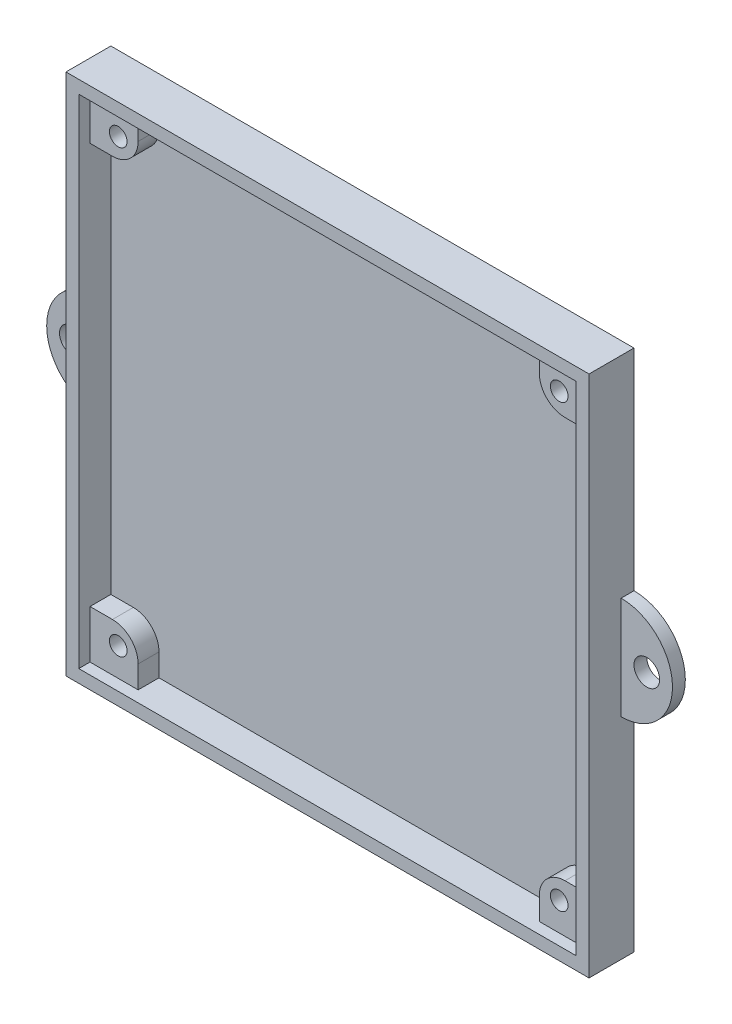
from build123d import *

# Parameters (mm, degrees)
SKETCH1_W           = 81.5
SKETCH1_H           = 81.5
BOSS_EXTRUDE2_DEPTH = 7
SKETCH3_W           = 77.5
SKETCH3_H           = 77.5
CUT_EXTRUDE2_DEPTH  = 5
SKETCH5_W           = 7.5
SKETCH5_H           = 7.5
BOSS_EXTRUDE3_DEPTH = 3.25
SKETCH4_R           = 1.375
CUT_EXTRUDE3_DEPTH  = 3.3
CUT_EXTRUDE4_DEPTH  = 1
FILLET1_R           = 4
SKETCH7_R           = 2
BOSS_EXTRUDE4_DEPTH = 2


with BuildPart() as part:
    # Sketch1 → Boss-Extrude2 (new body)
    with BuildSketch(Plane.XY):
        Rectangle(SKETCH1_W, SKETCH1_H)
    extrude(amount=BOSS_EXTRUDE2_DEPTH)

    # Sketch3 → Cut-Extrude2 (cut)
    with BuildSketch(Plane.XY.offset(7)):
        Rectangle(SKETCH3_W, SKETCH3_H)
    extrude(amount=-CUT_EXTRUDE2_DEPTH, mode=Mode.SUBTRACT)

    # Sketch5 → Boss-Extrude3 (add)
    with BuildSketch(Plane.XY.offset(2)):
        with Locations((-35, 35)):
            Rectangle(SKETCH5_W, SKETCH5_H)
        with Locations((35, 35)):
            Rectangle(SKETCH5_W, SKETCH5_H)
        with Locations((35, -35)):
            Rectangle(SKETCH5_W, SKETCH5_H)
        with Locations((-35, -35)):
            Rectangle(SKETCH5_W, SKETCH5_H)
    extrude(amount=BOSS_EXTRUDE3_DEPTH)

    # Sketch4 → Cut-Extrude3 (cut)
    with BuildSketch(Plane.XY.offset(5.25)):
        with Locations((-34.35, 34.35)):
            Circle(SKETCH4_R)
        with Locations((34.35, 34.35)):
            Circle(SKETCH4_R)
        with Locations((34.35, -34.35)):
            Circle(SKETCH4_R)
        with Locations((-34.35, -34.35)):
            Circle(SKETCH4_R)
    extrude(amount=-CUT_EXTRUDE3_DEPTH, mode=Mode.SUBTRACT)

    # Sketch6 → Cut-Extrude4 (cut)
    # profile 1 of 29: a face of its own
    with BuildSketch(Plane(origin=(0, 0, 0), x_dir=(-1, 0, 0), z_dir=(0, 0, -1))):
        Polygon((-12.80229786, 21.362535762), (-11.459028629, 21.362535762), (-10.132295857, 19.323463246), (-8.803019014, 21.362535762), (-7.458477748, 21.362535762), (-9.460661241, 18.291842653), (-7.326186081, 15.012535762), (-8.669455312, 15.012535762), (-10.132295857, 17.261494096), (-11.598952507, 15.012535762), (-12.943493773, 15.012535762), (-10.803930472, 18.293114689), align=None)
    # profile 2 of 29: a face of its own
    with BuildSketch(Plane(origin=(0, 0, 0), x_dir=(-1, 0, 0), z_dir=(0, 0, -1))):
        Polygon((-7.000545055, 21.362535762), (-5.732325905, 21.362535762), (-4.598942491, 19.135202028), (-3.465559078, 21.362535762), (-2.197339927, 21.362535762), (-4.029070696, 17.762675987), (-4.029070696, 15.012535762), (-5.168814286, 15.012535762), (-5.168814286, 17.762675987), align=None)
    # profile 3 of 29: a face of its own
    with BuildSketch(Plane(origin=(0, 0, 0), x_dir=(-1, 0, 0), z_dir=(0, 0, -1))):
        Polygon((-1.342532235, 21.362535762), (2.483749816, 21.362535762), (0.209350778, 16.152279352), (2.320929304, 16.152279352), (2.320929304, 15.012535762), (-1.505352748, 15.012535762), (0.770318326, 20.222792173), (-1.342532235, 20.222792173), align=None)
    # profile 4 of 29: a face of its own
    with BuildSketch(Plane(origin=(0, 0, 0), x_dir=(-1, 0, 0), z_dir=(0, 0, -1))):
        Polygon((3.053621611, 21.362535762), (6.879903663, 21.362535762), (4.605504624, 16.152279352), (6.71708315, 16.152279352), (6.71708315, 15.012535762), (2.890801099, 15.012535762), (5.166472172, 20.222792173), (3.053621611, 20.222792173), align=None)
    # profile 5 of 29: a face of its own
    with BuildSketch(Plane(origin=(0, 0, 0), x_dir=(-1, 0, 0), z_dir=(0, 0, -1))):
        Polygon((7.246249816, 21.362535762), (8.514468967, 21.362535762), (9.647852381, 19.135202028), (10.781235794, 21.362535762), (12.049454945, 21.362535762), (10.217724175, 17.762675987), (10.217724175, 15.012535762), (9.077980586, 15.012535762), (9.077980586, 17.762675987), align=None)
    # profile 6 of 29: a face of its own
    with BuildSketch(Plane(origin=(0, 0, 0), x_dir=(-1, 0, 0), z_dir=(0, 0, -1))):
        Polygon((-14.354180873, 10.023433198), (-13.171188084, 10.023433198), (-11.722339927, 5.594206436), (-10.263315488, 10.023433198), (-9.091771017, 10.023433198), (-8.01817326, 3.673433198), (-9.171909238, 3.673433198), (-9.84990403, 7.684160362), (-11.170276626, 3.673433198), (-12.28203544, 3.673433198), (-13.594775825, 7.684160362), (-14.271498581, 3.673433198), (-15.426506594, 3.673433198), align=None)
    # profile 7 of 29: a face of its own
    with BuildSketch(Plane(origin=(0, 0, 0), x_dir=(-1, 0, 0), z_dir=(0, 0, -1))):
        with BuildLine():
            add(Edge.make_bspline(
                [(-3.975645216, 10.186253711), (-3.865242683, 10.183395192), (-3.647283079, 10.177751827), (-3.326743154, 10.13070998), (-3.017843669, 10.054062034), (-2.720724307, 9.947515845), (-2.436129021, 9.8081856), (-2.163053947, 9.640021405), (-1.902477229, 9.439849259), (-1.657069047, 9.21233885), (-1.430267626, 8.964931214), (-1.233744063, 8.698552909), (-1.066155978, 8.420106063), (-0.927258524, 8.12884457), (-0.821462261, 7.822751306), (-0.747220646, 7.503386942), (-0.699524087, 7.170842333), (-0.694038249, 6.944424781), (-0.691250184, 6.829352669)],
                knots=[0, 0, 0, 0, 1.014329547, 2.002516266, 2.970391464, 3.935626869, 4.897733899, 5.877609409, 6.878433252, 7.912639331, 8.949961323, 9.958554974, 10.949718813, 11.932905612, 12.9188844, 13.919928257, 14.942845884, 16, 16, 16, 16], degree=3))
            add(Edge.make_bspline(
                [(-0.691250184, 6.829352669), (-0.694219353, 6.715577155), (-0.700070196, 6.491378853), (-0.745273464, 6.161898774), (-0.820765316, 5.845955468), (-0.924767193, 5.542833789), (-1.061145571, 5.254001954), (-1.225465506, 4.977615814), (-1.422063088, 4.716240297), (-1.643767632, 4.470015668), (-1.887845093, 4.246513982), (-2.146361872, 4.049553508), (-2.418124297, 3.882656635), (-2.702734595, 3.74589981), (-3.000803099, 3.639767874), (-3.311593543, 3.564884082), (-3.635086696, 3.519375689), (-3.855077728, 3.513563063), (-3.966740969, 3.510612686)],
                knots=[0, 0, 0, 0, 1.051557043, 2.072126891, 3.067553643, 4.050577992, 5.02905126, 6.015227836, 7.017913613, 8.04756643, 9.074058332, 10.072836633, 11.047628519, 12.017157415, 12.98668631, 13.966869689, 14.968021931, 16, 16, 16, 16], degree=3))
            add(Edge.make_bspline(
                [(-3.966740969, 3.510612686), (-4.08352733, 3.51325932), (-4.312996566, 3.518459595), (-4.648825821, 3.567911833), (-4.970579265, 3.642404179), (-5.275553984, 3.753580009), (-5.566855885, 3.892559146), (-5.842344688, 4.063720285), (-6.10192781, 4.266780569), (-6.34411624, 4.496539549), (-6.563539543, 4.747946267), (-6.757223649, 5.013535171), (-6.920600488, 5.291277394), (-7.05367604, 5.581302925), (-7.158587459, 5.881809327), (-7.232590544, 6.19462677), (-7.276305933, 6.519005005), (-7.282395233, 6.739329187), (-7.285480953, 6.850977269)],
                knots=[0, 0, 0, 0, 1.067978421, 2.098431617, 3.099715153, 4.085208694, 5.062210972, 6.048429807, 7.046490867, 8.072918869, 9.098532598, 10.095778865, 11.076610158, 12.041847152, 13.011192615, 13.984257998, 14.978533688, 16, 16, 16, 16], degree=3))
            add(Edge.make_bspline(
                [(-7.285480953, 6.850977269), (-7.284512476, 6.926088254), (-7.282587786, 7.075359146), (-7.259402867, 7.29657099), (-7.22602325, 7.513465075), (-7.17665638, 7.725176642), (-7.116688251, 7.933199218), (-7.038991068, 8.135596476), (-6.950550648, 8.334530577), (-6.847216344, 8.52765186), (-6.732318589, 8.713183446), (-6.606954908, 8.890250152), (-6.470810078, 9.056710982), (-6.324322664, 9.213659849), (-6.166987851, 9.360065115), (-6.000875217, 9.497999351), (-5.822763144, 9.623798533), (-5.636549946, 9.740534929), (-5.443285449, 9.846097627), (-5.243756417, 9.935949439), (-5.042073541, 10.014415496), (-4.835542611, 10.076344377), (-4.626376971, 10.126784803), (-4.412342112, 10.160141923), (-4.195371716, 10.183326199), (-4.049061201, 10.185275558), (-3.975645216, 10.186253711)],
                knots=[0, 0, 0, 0, 1.034744296, 2.056386356, 3.06226378, 4.057406941, 5.050368692, 6.043467995, 7.042652155, 8.049140477, 9.059438543, 10.048523776, 11.036952808, 12.020949711, 13.004946614, 13.997082645, 14.994316842, 16.007702937, 17.024872941, 18.026463647, 19.021641123, 20.005082605, 20.995858141, 21.984425357, 22.988620895, 24, 24, 24, 24], degree=3))
        make_face()
        with BuildLine():
            add(Edge.make_bspline(
                [(-3.993453709, 9.046510121), (-4.067754599, 9.044516462), (-4.214394822, 9.040581775), (-4.429489325, 9.010604786), (-4.635987643, 8.962728128), (-4.832745076, 8.893379373), (-5.020614387, 8.805116008), (-5.19992861, 8.698246437), (-5.368204613, 8.569097138), (-5.527686195, 8.424601561), (-5.671751562, 8.26360028), (-5.799037858, 8.091060027), (-5.905555986, 7.90726894), (-5.994765585, 7.713934396), (-6.061920642, 7.508882398), (-6.109753175, 7.293719142), (-6.139981551, 7.068073889), (-6.143791875, 6.914251815), (-6.145737363, 6.835712846)],
                knots=[0, 0, 0, 0, 1.033739768, 2.040188636, 3.016340934, 3.979330865, 4.937572243, 5.900995986, 6.878200029, 7.884839167, 8.891893314, 9.879764717, 10.863503415, 11.843163062, 12.837761627, 13.859916423, 14.907309254, 16, 16, 16, 16], degree=3))
            add(Edge.make_bspline(
                [(-6.145737363, 6.835712846), (-6.143157943, 6.748674001), (-6.138102708, 6.578092287), (-6.10253346, 6.329252279), (-6.041678018, 6.094247588), (-5.953803941, 5.874227588), (-5.844817033, 5.666749121), (-5.70947259, 5.474355132), (-5.549962552, 5.295893653), (-5.42707731, 5.191700409), (-5.364707716, 5.138817814)],
                knots=[0, 0, 0, 0, 1.078454662, 2.113592447, 3.107694534, 4.079536787, 5.043276885, 6.005368276, 6.987637804, 8, 8, 8, 8], degree=3))
            add(Edge.make_bspline(
                [(-5.364707716, 5.138817814), (-5.31361511, 5.099750184), (-5.212581025, 5.022495124), (-5.051308627, 4.923476916), (-4.885229814, 4.838608434), (-4.713091312, 4.770035705), (-4.535256669, 4.716097549), (-4.351750271, 4.678325545), (-4.162832132, 4.654620346), (-4.035076832, 4.651787125), (-3.970557075, 4.650356275)],
                knots=[0, 0, 0, 0, 1.023928204, 2.024787132, 3.009472467, 3.9914905, 4.972207045, 5.96565515, 6.972602802, 8, 8, 8, 8], degree=3))
            add(Edge.make_bspline(
                [(-3.970557075, 4.650356275), (-3.89753379, 4.652366839), (-3.753858183, 4.656322686), (-3.54276778, 4.685930642), (-3.340536764, 4.736037993), (-3.145909665, 4.804778396), (-2.959447703, 4.894149984), (-2.782062167, 5.004334313), (-2.613442052, 5.133978464), (-2.454163647, 5.280371585), (-2.308575656, 5.442007099), (-2.18155498, 5.615467664), (-2.071650108, 5.796931425), (-1.984295623, 5.988966725), (-1.914487422, 6.189760842), (-1.867230578, 6.400203049), (-1.836746841, 6.619425824), (-1.832935443, 6.76861467), (-1.830993773, 6.844617093)],
                knots=[0, 0, 0, 0, 1.026359118, 2.019393844, 2.989460624, 3.950973911, 4.916101784, 5.890408035, 6.881132271, 7.902007068, 8.92769091, 9.933912415, 10.920395702, 11.90457117, 12.894218921, 13.903490204, 14.931958862, 16, 16, 16, 16], degree=3))
            add(Edge.make_bspline(
                [(-1.830993773, 6.844617093), (-1.833002625, 6.920182481), (-1.836956744, 7.068921423), (-1.866616811, 7.287580577), (-1.916406394, 7.497093744), (-1.985353218, 7.697803079), (-2.07339466, 7.889905354), (-2.182266836, 8.072725022), (-2.311587724, 8.246085341), (-2.458381015, 8.408804928), (-2.61815649, 8.558333805), (-2.789691426, 8.688097689), (-2.968186085, 8.800858378), (-3.157736003, 8.889190549), (-3.35446315, 8.959564602), (-3.559567963, 9.011389065), (-3.773827291, 9.040371185), (-3.919592342, 9.044445569), (-3.993453709, 9.046510121)],
                knots=[0, 0, 0, 0, 1.055025985, 2.07665775, 3.074803781, 4.057872707, 5.035505728, 6.020516407, 7.023567878, 8.050795229, 9.077271434, 10.074415901, 11.050397877, 12.019801805, 12.988065821, 13.964604439, 14.968634123, 16, 16, 16, 16], degree=3))
        make_face(mode=Mode.SUBTRACT)
    # profile 8 of 29: a face of its own
    with BuildSketch(Plane(origin=(0, 0, 0), x_dir=(-1, 0, 0), z_dir=(0, 0, -1))):
        Polygon((-0.202788645, 10.023433198), (3.216442124, 10.023433198), (3.216442124, 8.883689609), (2.076698534, 8.883689609), (2.076698534, 3.673433198), (0.936954945, 3.673433198), (0.936954945, 8.883689609), (-0.202788645, 8.883689609), align=None)
    # profile 9 of 29: a face of its own
    with BuildSketch(Plane(origin=(0, 0, 0), x_dir=(-1, 0, 0), z_dir=(0, 0, -1))):
        with BuildLine():
            add(Edge.make_bspline(
                [(7.096149656, 10.186253711), (7.206552189, 10.183395192), (7.424511793, 10.177751827), (7.745051718, 10.13070998), (8.053951203, 10.054062034), (8.351070565, 9.947515845), (8.635665851, 9.8081856), (8.908740924, 9.640021405), (9.169317643, 9.439849259), (9.414725825, 9.21233885), (9.641527245, 8.964931214), (9.838050809, 8.698552909), (10.005638894, 8.420106063), (10.144536347, 8.12884457), (10.250332611, 7.822751306), (10.324574226, 7.503386942), (10.372270785, 7.170842333), (10.377756623, 6.944424781), (10.380544688, 6.829352669)],
                knots=[0, 0, 0, 0, 1.014329547, 2.002516266, 2.970391464, 3.935626869, 4.897733899, 5.877609409, 6.878433252, 7.912639331, 8.949961323, 9.958554974, 10.949718813, 11.932905612, 12.9188844, 13.919928257, 14.942845884, 16, 16, 16, 16], degree=3))
            add(Edge.make_bspline(
                [(10.380544688, 6.829352669), (10.377575519, 6.715577155), (10.371724676, 6.491378853), (10.326521408, 6.161898774), (10.251029555, 5.845955468), (10.147027679, 5.542833789), (10.010649301, 5.254001954), (9.846329366, 4.977615814), (9.649731783, 4.716240297), (9.42802724, 4.470015668), (9.183949778, 4.246513982), (8.925433, 4.049553508), (8.653670574, 3.882656635), (8.369060277, 3.74589981), (8.070991773, 3.639767874), (7.760201329, 3.564884082), (7.436708176, 3.519375689), (7.216717144, 3.513563063), (7.105053903, 3.510612686)],
                knots=[0, 0, 0, 0, 1.051557043, 2.072126891, 3.067553643, 4.050577992, 5.02905126, 6.015227836, 7.017913613, 8.04756643, 9.074058332, 10.072836633, 11.047628519, 12.017157415, 12.98668631, 13.966869689, 14.968021931, 16, 16, 16, 16], degree=3))
            add(Edge.make_bspline(
                [(7.105053903, 3.510612686), (6.988267542, 3.51325932), (6.758798306, 3.518459595), (6.422969051, 3.567911833), (6.101215607, 3.642404179), (5.796240888, 3.753580009), (5.504938986, 3.892559146), (5.229450184, 4.063720285), (4.969867062, 4.266780569), (4.727678632, 4.496539549), (4.508255329, 4.747946267), (4.314571223, 5.013535171), (4.151194383, 5.291277394), (4.018118832, 5.581302925), (3.913207413, 5.881809327), (3.839204327, 6.19462677), (3.795488939, 6.519005005), (3.789399639, 6.739329187), (3.786313919, 6.850977269)],
                knots=[0, 0, 0, 0, 1.067978421, 2.098431617, 3.099715153, 4.085208694, 5.062210972, 6.048429807, 7.046490867, 8.072918869, 9.098532598, 10.095778865, 11.076610158, 12.041847152, 13.011192615, 13.984257998, 14.978533688, 16, 16, 16, 16], degree=3))
            add(Edge.make_bspline(
                [(3.786313919, 6.850977269), (3.787282396, 6.926088254), (3.789207086, 7.075359146), (3.812392004, 7.29657099), (3.845771622, 7.513465075), (3.895138491, 7.725176642), (3.955106621, 7.933199218), (4.032803803, 8.135596476), (4.121244224, 8.334530577), (4.224578528, 8.52765186), (4.339476283, 8.713183446), (4.464839963, 8.890250152), (4.600984794, 9.056710982), (4.747472208, 9.213659849), (4.904807021, 9.360065115), (5.070919655, 9.497999351), (5.249031728, 9.623798533), (5.435244926, 9.740534929), (5.628509422, 9.846097627), (5.828038454, 9.935949439), (6.02972133, 10.014415496), (6.236252261, 10.076344377), (6.445417901, 10.126784803), (6.65945276, 10.160141923), (6.876423156, 10.183326199), (7.022733671, 10.185275558), (7.096149656, 10.186253711)],
                knots=[0, 0, 0, 0, 1.034744296, 2.056386356, 3.06226378, 4.057406941, 5.050368692, 6.043467995, 7.042652155, 8.049140477, 9.059438543, 10.048523776, 11.036952808, 12.020949711, 13.004946614, 13.997082645, 14.994316842, 16.007702937, 17.024872941, 18.026463647, 19.021641123, 20.005082605, 20.995858141, 21.984425357, 22.988620895, 24, 24, 24, 24], degree=3))
        make_face()
        with BuildLine():
            add(Edge.make_bspline(
                [(7.078341163, 9.046510121), (7.004040273, 9.044516462), (6.857400049, 9.040581775), (6.642305547, 9.010604786), (6.435807228, 8.962728128), (6.239049796, 8.893379373), (6.051180485, 8.805116008), (5.871866262, 8.698246437), (5.703590259, 8.569097138), (5.544108677, 8.424601561), (5.40004331, 8.26360028), (5.272757014, 8.091060027), (5.166238886, 7.90726894), (5.077029287, 7.713934396), (5.00987423, 7.508882398), (4.962041696, 7.293719142), (4.931813321, 7.068073889), (4.928002996, 6.914251815), (4.926057509, 6.835712846)],
                knots=[0, 0, 0, 0, 1.033739768, 2.040188636, 3.016340934, 3.979330865, 4.937572243, 5.900995986, 6.878200029, 7.884839167, 8.891893314, 9.879764717, 10.863503415, 11.843163062, 12.837761627, 13.859916423, 14.907309254, 16, 16, 16, 16], degree=3))
            add(Edge.make_bspline(
                [(4.926057509, 6.835712846), (4.928636928, 6.748674001), (4.933692163, 6.578092287), (4.969261411, 6.329252279), (5.030116854, 6.094247588), (5.11799093, 5.874227588), (5.226977839, 5.666749121), (5.362322282, 5.474355132), (5.52183232, 5.295893653), (5.644717561, 5.191700409), (5.707087156, 5.138817814)],
                knots=[0, 0, 0, 0, 1.078454662, 2.113592447, 3.107694534, 4.079536787, 5.043276885, 6.005368276, 6.987637804, 8, 8, 8, 8], degree=3))
            add(Edge.make_bspline(
                [(5.707087156, 5.138817814), (5.758179762, 5.099750184), (5.859213847, 5.022495124), (6.020486245, 4.923476916), (6.186565058, 4.838608434), (6.35870356, 4.770035705), (6.536538203, 4.716097549), (6.720044601, 4.678325545), (6.90896274, 4.654620346), (7.03671804, 4.651787125), (7.101237797, 4.650356275)],
                knots=[0, 0, 0, 0, 1.023928204, 2.024787132, 3.009472467, 3.9914905, 4.972207045, 5.96565515, 6.972602802, 8, 8, 8, 8], degree=3))
            add(Edge.make_bspline(
                [(7.101237797, 4.650356275), (7.174261081, 4.652366839), (7.317936689, 4.656322686), (7.529027091, 4.685930642), (7.731258108, 4.736037993), (7.925885206, 4.804778396), (8.112347169, 4.894149984), (8.289732705, 5.004334313), (8.45835282, 5.133978464), (8.617631225, 5.280371585), (8.763219216, 5.442007099), (8.890239892, 5.615467664), (9.000144764, 5.796931425), (9.087499249, 5.988966725), (9.15730745, 6.189760842), (9.204564294, 6.400203049), (9.235048031, 6.619425824), (9.238859429, 6.76861467), (9.240801099, 6.844617093)],
                knots=[0, 0, 0, 0, 1.026359118, 2.019393844, 2.989460624, 3.950973911, 4.916101784, 5.890408035, 6.881132271, 7.902007068, 8.92769091, 9.933912415, 10.920395702, 11.90457117, 12.894218921, 13.903490204, 14.931958862, 16, 16, 16, 16], degree=3))
            add(Edge.make_bspline(
                [(9.240801099, 6.844617093), (9.238792247, 6.920182481), (9.234838128, 7.068921423), (9.205178061, 7.287580577), (9.155388477, 7.497093744), (9.086441654, 7.697803079), (8.998400212, 7.889905354), (8.889528036, 8.072725022), (8.760207147, 8.246085341), (8.613413857, 8.408804928), (8.453638382, 8.558333805), (8.282103446, 8.688097689), (8.103608787, 8.800858378), (7.914058868, 8.889190549), (7.717331722, 8.959564602), (7.512226908, 9.011389065), (7.297967581, 9.040371185), (7.15220253, 9.044445569), (7.078341163, 9.046510121)],
                knots=[0, 0, 0, 0, 1.055025985, 2.07665775, 3.074803781, 4.057872707, 5.035505728, 6.020516407, 7.023567878, 8.050795229, 9.077271434, 10.074415901, 11.050397877, 12.019801805, 12.988065821, 13.964604439, 14.968634123, 16, 16, 16, 16], degree=3))
        make_face(mode=Mode.SUBTRACT)
    # profile 10 of 29: a face of its own
    with BuildSketch(Plane(origin=(0, 0, 0), x_dir=(-1, 0, 0), z_dir=(0, 0, -1))):
        with BuildLine():
            Line((11.520288278, 10.023433198), (12.848293086, 10.023433198))
            add(Edge.make_bspline(
                [(12.848293086, 10.023433198), (12.936073799, 10.023121627), (13.104900838, 10.022522388), (13.348340207, 10.013067982), (13.571972745, 9.999911401), (13.776129561, 9.979834109), (13.960723314, 9.953214046), (14.12593901, 9.921833397), (14.271771818, 9.886068419), (14.399451639, 9.841502436), (14.514676363, 9.791232682), (14.622081825, 9.733471813), (14.72403755, 9.668863014), (14.819862073, 9.595706253), (14.910388132, 9.515317603), (14.99578651, 9.427616144), (15.074850448, 9.331858203), (15.14709038, 9.22864885), (15.212931263, 9.120074978), (15.271120794, 9.005987513), (15.318440618, 8.886307116), (15.360252755, 8.762763426), (15.390368682, 8.633590364), (15.411313869, 8.500045449), (15.426649116, 8.361658591), (15.427530819, 8.267644704), (15.427980586, 8.219687205)],
                knots=[0, 0, 0, 0, 1.749336639, 3.364467119, 4.854658419, 6.213483162, 7.451590619, 8.570285859, 9.5643256, 10.440900261, 11.26203566, 12.067320669, 12.869050712, 13.665104639, 14.467235401, 15.27997916, 16.102287765, 16.939272006, 17.78853747, 18.631303466, 19.488103222, 20.351255419, 21.228522269, 22.127379805, 23.044756219, 24, 24, 24, 24], degree=3))
            add(Edge.make_bspline(
                [(15.427980586, 8.219687205), (15.426812254, 8.169630593), (15.424521369, 8.0714787), (15.412181417, 7.927301574), (15.389627861, 7.789362986), (15.355467218, 7.6580668), (15.316203997, 7.531778885), (15.263993984, 7.41282933), (15.205069824, 7.299488188), (15.135087321, 7.19335871), (15.058284943, 7.09208355), (14.968965392, 6.999542934), (14.872915205, 6.910763155), (14.764735049, 6.831305077), (14.649193607, 6.755796032), (14.523995192, 6.687364729), (14.389956892, 6.624290961), (14.295721329, 6.589116671), (14.247531868, 6.571129512)],
                knots=[0, 0, 0, 0, 1.099860209, 2.156625411, 3.176576793, 4.16617041, 5.135385252, 6.078461593, 7.016046972, 7.938469504, 8.868247731, 9.803980173, 10.76021508, 11.73834243, 12.748633912, 13.790971185, 14.870363756, 16, 16, 16, 16], degree=3))
            Line((14.247531868, 6.571129512), (15.712916483, 3.673433198))
            Line((15.712916483, 3.673433198), (14.445969368, 3.673433198))
            Line((14.445969368, 3.673433198), (13.046730586, 6.441381916))
            Line((13.046730586, 6.441381916), (12.660031868, 6.441381916))
            Line((12.660031868, 6.441381916), (12.660031868, 3.673433198))
            Line((12.660031868, 3.673433198), (11.520288278, 3.673433198))
            Line((11.520288278, 3.673433198), (11.520288278, 10.023433198))
        make_face()
        with BuildLine():
            Line((12.660031868, 7.581125506), (13.103972172, 7.581125506))
            add(Edge.make_bspline(
                [(13.103972172, 7.581125506), (13.158247565, 7.581736792), (13.262173279, 7.582907273), (13.411632106, 7.58833645), (13.547376365, 7.601418085), (13.669988987, 7.617946241), (13.780086949, 7.637030384), (13.876688215, 7.664379119), (13.961281263, 7.693683982), (14.032863662, 7.730102324), (14.09402202, 7.771517878), (14.146828347, 7.818566977), (14.190506751, 7.873020318), (14.226456306, 7.933398094), (14.254421151, 8.000234332), (14.274833345, 8.072795322), (14.286240743, 8.151907626), (14.287553203, 8.206505888), (14.288236996, 8.234951628)],
                knots=[0, 0, 0, 0, 1.688639943, 3.233382647, 4.650958383, 5.928841754, 7.082724185, 8.122798841, 9.049171256, 9.863274652, 10.613301712, 11.341792392, 12.054588806, 12.776240173, 13.521029143, 14.301969904, 15.115324896, 16, 16, 16, 16], degree=3))
            add(Edge.make_bspline(
                [(14.288236996, 8.234951628), (14.286944223, 8.268605015), (14.28440481, 8.334710858), (14.259205947, 8.429880093), (14.219094799, 8.517965731), (14.164113401, 8.598569779), (14.094871479, 8.669232852), (14.015410911, 8.731522914), (13.924016745, 8.780777234), (13.839392624, 8.813264859), (13.762404455, 8.83270254), (13.692925061, 8.847187329), (13.612467505, 8.857453114), (13.520971045, 8.868341806), (13.418668909, 8.875402572), (13.30500349, 8.880555524), (13.180301232, 8.882663849), (13.093371915, 8.883337844), (13.048002621, 8.883689609)],
                knots=[0, 0, 0, 0, 1.020303359, 2.004196876, 2.966617323, 3.9489082, 4.950758222, 5.960522915, 7.003732012, 8.091992268, 8.70421221, 9.413913587, 10.24622431, 11.166358409, 12.212345909, 13.359657661, 14.621978493, 16, 16, 16, 16], degree=3))
            Line((13.048002621, 8.883689609), (12.660031868, 8.883689609))
            Line((12.660031868, 8.883689609), (12.660031868, 7.581125506))
        make_face(mode=Mode.SUBTRACT)
    # profile 11 of 29: a face of its own
    with BuildSketch(Plane(origin=(0, 0, 0), x_dir=(-1, 0, 0), z_dir=(0, 0, -1))):
        with BuildLine():
            Line((-18.927147619, -2.417251898), (-19.762874783, -3.216090039))
            add(Edge.make_bspline(
                [(-19.762874783, -3.216090039), (-19.833767969, -3.142786365), (-19.972244573, -2.999601325), (-20.195382493, -2.810036951), (-20.427437806, -2.652060694), (-20.663896338, -2.519014096), (-20.909011293, -2.418354862), (-21.159948474, -2.345002783), (-21.41831019, -2.300282793), (-21.593159462, -2.295166035), (-21.68110395, -2.292592443)],
                knots=[0, 0, 0, 0, 1.115251505, 2.178435587, 3.19620269, 4.182487026, 5.141301733, 6.088180966, 7.038406374, 8, 8, 8, 8], degree=3))
            add(Edge.make_bspline(
                [(-21.68110395, -2.292592443), (-21.754548284, -2.29462567), (-21.899482586, -2.298638021), (-22.112284122, -2.32805251), (-22.315839788, -2.378073127), (-22.510846389, -2.447010804), (-22.696730109, -2.536212499), (-22.873880676, -2.645609172), (-23.041861333, -2.774212817), (-23.198453153, -2.92135803), (-23.341697847, -3.082125234), (-23.468263655, -3.253663456), (-23.574282821, -3.435579713), (-23.661291027, -3.626031691), (-23.729067055, -3.825900895), (-23.777467655, -4.035052766), (-23.805461268, -4.253736388), (-23.809639502, -4.402395884), (-23.811763004, -4.477949013)],
                knots=[0, 0, 0, 0, 1.035432265, 2.043311493, 3.022114605, 3.98653278, 4.95457646, 5.923598177, 6.917315552, 7.932509744, 8.948865224, 9.949768934, 10.933144597, 11.912367597, 12.897413939, 13.903909035, 14.934704909, 16, 16, 16, 16], degree=3))
            add(Edge.make_bspline(
                [(-23.811763004, -4.477949013), (-23.811151035, -4.530977486), (-23.809944832, -4.635497694), (-23.796740803, -4.790112091), (-23.775479202, -4.940124609), (-23.744708399, -5.085308018), (-23.706229207, -5.225788137), (-23.661084353, -5.362776879), (-23.604450797, -5.494381369), (-23.541586696, -5.622130107), (-23.468476471, -5.742537309), (-23.389650162, -5.85735557), (-23.304175899, -5.966022061), (-23.211500061, -6.06809255), (-23.11031835, -6.161971905), (-23.00324594, -6.250483188), (-22.888476667, -6.331410664), (-22.768394579, -6.406785295), (-22.64196232, -6.472263879), (-22.51261029, -6.531574826), (-22.37837725, -6.579744133), (-22.240897569, -6.618572989), (-22.100662552, -6.651591132), (-21.956300568, -6.671921417), (-21.809063056, -6.687317304), (-21.709555212, -6.68826791), (-21.65947935, -6.688746289)],
                knots=[0, 0, 0, 0, 1.103660481, 2.175337485, 3.227646561, 4.255952547, 5.262355991, 6.258840057, 7.255597736, 8.242457506, 9.22035537, 10.185017736, 11.140346927, 12.096287581, 13.051739095, 14.01125915, 14.986044842, 15.97314143, 16.960198552, 17.947847494, 18.933482797, 19.925264591, 20.920966487, 21.929612487, 22.958107872, 24, 24, 24, 24], degree=3))
            add(Edge.make_bspline(
                [(-21.65947935, -6.688746289), (-21.574542082, -6.686289452), (-21.407662438, -6.681462407), (-21.162742565, -6.6437156), (-20.929358326, -6.581624237), (-20.742885435, -6.508297946), (-20.596788851, -6.435887282), (-20.485567681, -6.368910983), (-20.370556323, -6.293990639), (-20.253665017, -6.208298676), (-20.133578968, -6.11286343), (-20.012417971, -6.005594693), (-19.887080283, -5.890024669), (-19.804972806, -5.807540072), (-19.762874783, -5.765248693)],
                knots=[0, 0, 0, 0, 1.404581149, 2.759636711, 4.088442092, 5.392261763, 6.066678138, 6.783632037, 7.538459478, 8.336747902, 9.180226004, 10.074962426, 11.012997595, 12, 12, 12, 12], degree=3))
            Line((-19.762874783, -5.765248693), (-18.952588325, -6.616240279))
            add(Edge.make_bspline(
                [(-18.952588325, -6.616240279), (-19.009547101, -6.67123219), (-19.120718452, -6.778564639), (-19.288417349, -6.930966701), (-19.455905189, -7.067916896), (-19.619135817, -7.194385915), (-19.78078312, -7.306689409), (-19.940829955, -7.404939536), (-20.097464523, -7.491621185), (-20.25393939, -7.565272512), (-20.411228224, -7.627810137), (-20.57305995, -7.681650928), (-20.739929303, -7.727198301), (-20.912855444, -7.763949048), (-21.090225425, -7.793418186), (-21.273699193, -7.813309684), (-21.462113433, -7.826682077), (-21.589917731, -7.827883697), (-21.654391209, -7.828489879)],
                knots=[0, 0, 0, 0, 1.244526981, 2.429050516, 3.560637417, 4.644440555, 5.67424972, 6.652764056, 7.595344123, 8.486817594, 9.369275933, 10.254498637, 11.166417451, 12.086725134, 13.032340136, 13.991389299, 14.986715468, 16, 16, 16, 16], degree=3))
            add(Edge.make_bspline(
                [(-21.654391209, -7.828489879), (-21.772821002, -7.825470867), (-22.004555188, -7.8195635), (-22.344155595, -7.775793914), (-22.666766865, -7.702414974), (-22.973173852, -7.598636912), (-23.263279126, -7.466065302), (-23.537008467, -7.303538734), (-23.793920686, -7.111489014), (-24.031940438, -6.892167152), (-24.247240631, -6.649944567), (-24.437541069, -6.389863963), (-24.594957598, -6.110647138), (-24.725663934, -5.816419016), (-24.82787457, -5.505836921), (-24.89981353, -5.178564898), (-24.944177762, -4.834918947), (-24.949031272, -4.600200841), (-24.951506594, -4.480493084)],
                knots=[0, 0, 0, 0, 1.078019885, 2.10938526, 3.111377082, 4.085535484, 5.04941344, 6.010039228, 6.978205633, 7.964457913, 8.951525778, 9.924444315, 10.892603023, 11.863865945, 12.85144698, 13.863884204, 14.910567087, 16, 16, 16, 16], degree=3))
            add(Edge.make_bspline(
                [(-24.951506594, -4.480493084), (-24.950460643, -4.402420706), (-24.948387824, -4.247700335), (-24.926602303, -4.019784694), (-24.89623202, -3.797607711), (-24.848052328, -3.583476321), (-24.789976461, -3.374505778), (-24.717751491, -3.172967348), (-24.631492769, -2.97828179), (-24.533980619, -2.790123188), (-24.423666099, -2.609724182), (-24.30043267, -2.438634685), (-24.167452841, -2.275533917), (-24.021531323, -2.122585712), (-23.864788547, -1.978447156), (-23.696516838, -1.843899362), (-23.517728265, -1.717012765), (-23.327938915, -1.60105946), (-23.130835889, -1.496173533), (-22.928905174, -1.403659666), (-22.722642892, -1.326339377), (-22.512921137, -1.26220505), (-22.298853838, -1.214333309), (-22.081968953, -1.178095946), (-21.860421052, -1.157839028), (-21.71167083, -1.154522842), (-21.636582716, -1.152848853)],
                knots=[0, 0, 0, 0, 1.071919942, 2.124283339, 3.142214191, 4.149696895, 5.136002878, 6.119640489, 7.086990633, 8.058538607, 9.028339693, 9.988281803, 10.952401235, 11.916291999, 12.888973767, 13.874849856, 14.873389453, 15.898127285, 16.927174885, 17.938320013, 18.946391617, 19.950418109, 20.947802303, 21.956882652, 22.968648068, 24, 24, 24, 24], degree=3))
            add(Edge.make_bspline(
                [(-21.636582716, -1.152848853), (-21.572524855, -1.153808425), (-21.445075157, -1.155717593), (-21.25528117, -1.17163258), (-21.067005067, -1.196626908), (-20.880920933, -1.234338025), (-20.695697705, -1.279105886), (-20.513769423, -1.337723225), (-20.332266071, -1.403063297), (-20.154034259, -1.48116401), (-19.978825201, -1.566417994), (-19.810743446, -1.663141734), (-19.646966916, -1.765382961), (-19.491124802, -1.879192757), (-19.340297845, -2.00044303), (-19.195274731, -2.12969948), (-19.057328124, -2.269117192), (-18.970760493, -2.367624035), (-18.927147619, -2.417251898)],
                knots=[0, 0, 0, 0, 0.996412454, 1.982464992, 2.961075852, 3.949442424, 4.934965278, 5.923860011, 6.921385422, 7.934793307, 8.949617135, 9.951082467, 10.950285876, 11.951772932, 12.951063433, 13.960125323, 14.972308753, 16, 16, 16, 16], degree=3))
        make_face()
    # profile 12 of 29: a face of its own
    with BuildSketch(Plane(origin=(0, 0, 0), x_dir=(-1, 0, 0), z_dir=(0, 0, -1))):
        with BuildLine():
            add(Edge.make_bspline(
                [(-14.803209318, -1.152848853), (-14.692806786, -1.155707372), (-14.474847181, -1.161350737), (-14.154307257, -1.208392584), (-13.845407771, -1.28504053), (-13.548288409, -1.391586719), (-13.263693123, -1.530916964), (-12.99061805, -1.699081159), (-12.730041332, -1.899253305), (-12.484633149, -2.126763714), (-12.257831729, -2.37417135), (-12.061308166, -2.640549656), (-11.89372008, -2.918996501), (-11.754822627, -3.210257994), (-11.649026363, -3.516351258), (-11.574784749, -3.835715623), (-11.52708819, -4.168260231), (-11.521602352, -4.394677783), (-11.518814286, -4.509749895)],
                knots=[0, 0, 0, 0, 1.014329547, 2.002516266, 2.970391464, 3.935626869, 4.897733899, 5.877609409, 6.878433252, 7.912639331, 8.949961323, 9.958554974, 10.949718813, 11.932905612, 12.9188844, 13.919928257, 14.942845884, 16, 16, 16, 16], degree=3))
            add(Edge.make_bspline(
                [(-11.518814286, -4.509749895), (-11.521783455, -4.623525409), (-11.527634298, -4.847723711), (-11.572837566, -5.17720379), (-11.648329419, -5.493147096), (-11.752331295, -5.796268776), (-11.888709674, -6.08510061), (-12.053029609, -6.36148675), (-12.249627191, -6.622862267), (-12.471331734, -6.869086897), (-12.715409196, -7.092588582), (-12.973925975, -7.289549056), (-13.2456884, -7.456445929), (-13.530298698, -7.593202754), (-13.828367202, -7.69933469), (-14.139157646, -7.774218482), (-14.462650799, -7.819726875), (-14.68264183, -7.825539501), (-14.794305071, -7.828489879)],
                knots=[0, 0, 0, 0, 1.051557043, 2.072126891, 3.067553643, 4.050577992, 5.02905126, 6.015227836, 7.017913613, 8.04756643, 9.074058332, 10.072836633, 11.047628519, 12.017157415, 12.98668631, 13.966869689, 14.968021931, 16, 16, 16, 16], degree=3))
            add(Edge.make_bspline(
                [(-14.794305071, -7.828489879), (-14.911091432, -7.825843244), (-15.140560669, -7.82064297), (-15.476389923, -7.771190731), (-15.798143368, -7.696698385), (-16.103118087, -7.585522555), (-16.394419988, -7.446543418), (-16.669908791, -7.275382279), (-16.929491913, -7.072321995), (-17.171680342, -6.842563015), (-17.391103646, -6.591156297), (-17.584787751, -6.325567393), (-17.748164591, -6.047825171), (-17.881240142, -5.757799639), (-17.986151561, -5.457293237), (-18.060154647, -5.144475794), (-18.103870036, -4.820097559), (-18.109959336, -4.599773378), (-18.113045055, -4.488125295)],
                knots=[0, 0, 0, 0, 1.067978421, 2.098431617, 3.099715153, 4.085208694, 5.062210972, 6.048429807, 7.046490867, 8.072918869, 9.098532598, 10.095778865, 11.076610158, 12.041847152, 13.011192615, 13.984257998, 14.978533688, 16, 16, 16, 16], degree=3))
            add(Edge.make_bspline(
                [(-18.113045055, -4.488125295), (-18.112076579, -4.41301431), (-18.110151889, -4.263743418), (-18.08696697, -4.042531574), (-18.053587353, -3.825637489), (-18.004220483, -3.613925922), (-17.944252354, -3.405903346), (-17.866555171, -3.203506088), (-17.778114751, -3.004571987), (-17.674780446, -2.811450704), (-17.559882691, -2.625919118), (-17.434519011, -2.448852412), (-17.29837418, -2.282391582), (-17.151886766, -2.125442715), (-16.994551954, -1.979037449), (-16.82843932, -1.841103213), (-16.650327246, -1.715304031), (-16.464114048, -1.598567635), (-16.270849552, -1.493004937), (-16.07132052, -1.403153125), (-15.869637644, -1.324687068), (-15.663106713, -1.262758187), (-15.453941074, -1.212317761), (-15.239906214, -1.178960641), (-15.022935818, -1.155776365), (-14.876625303, -1.153827006), (-14.803209318, -1.152848853)],
                knots=[0, 0, 0, 0, 1.034744296, 2.056386356, 3.06226378, 4.057406941, 5.050368692, 6.043467995, 7.042652155, 8.049140477, 9.059438543, 10.048523776, 11.036952808, 12.020949711, 13.004946614, 13.997082645, 14.994316842, 16.007702937, 17.024872941, 18.026463647, 19.021641123, 20.005082605, 20.995858141, 21.984425357, 22.988620895, 24, 24, 24, 24], degree=3))
        make_face()
        with BuildLine():
            add(Edge.make_bspline(
                [(-14.821017812, -2.292592443), (-14.895318701, -2.294586102), (-15.041958925, -2.298520789), (-15.257053428, -2.328497778), (-15.463551746, -2.376374436), (-15.660309179, -2.445723191), (-15.848178489, -2.533986556), (-16.027492712, -2.640856127), (-16.195768716, -2.770005426), (-16.355250298, -2.914501004), (-16.499315664, -3.075502284), (-16.62660196, -3.248042537), (-16.733120088, -3.431833624), (-16.822329688, -3.625168168), (-16.889484744, -3.830220166), (-16.937317278, -4.045383422), (-16.967545654, -4.271028675), (-16.971355978, -4.424850749), (-16.973301466, -4.503389718)],
                knots=[0, 0, 0, 0, 1.033739768, 2.040188636, 3.016340934, 3.979330865, 4.937572243, 5.900995986, 6.878200029, 7.884839167, 8.891893314, 9.879764717, 10.863503415, 11.843163062, 12.837761627, 13.859916423, 14.907309254, 16, 16, 16, 16], degree=3))
            add(Edge.make_bspline(
                [(-16.973301466, -4.503389718), (-16.970722046, -4.590428563), (-16.965666811, -4.761010277), (-16.930097563, -5.009850285), (-16.86924212, -5.244854976), (-16.781368044, -5.464874976), (-16.672381136, -5.672353443), (-16.537036693, -5.864747433), (-16.377526654, -6.043208911), (-16.254641413, -6.147402155), (-16.192271818, -6.20028475)],
                knots=[0, 0, 0, 0, 1.078454662, 2.113592447, 3.107694534, 4.079536787, 5.043276885, 6.005368276, 6.987637804, 8, 8, 8, 8], degree=3))
            add(Edge.make_bspline(
                [(-16.192271818, -6.20028475), (-16.141179213, -6.239352381), (-16.040145127, -6.31660744), (-15.87887273, -6.415625648), (-15.712793916, -6.50049413), (-15.540655414, -6.569066859), (-15.362820771, -6.623005015), (-15.179314373, -6.660777019), (-14.990396234, -6.684482218), (-14.862640935, -6.687315439), (-14.798121177, -6.688746289)],
                knots=[0, 0, 0, 0, 1.023928204, 2.024787132, 3.009472467, 3.9914905, 4.972207045, 5.96565515, 6.972602802, 8, 8, 8, 8], degree=3))
            add(Edge.make_bspline(
                [(-14.798121177, -6.688746289), (-14.725097893, -6.686735725), (-14.581422285, -6.682779878), (-14.370331883, -6.653171922), (-14.168100866, -6.603064571), (-13.973473768, -6.534324168), (-13.787011805, -6.44495258), (-13.609626269, -6.334768251), (-13.441006154, -6.2051241), (-13.28172775, -6.058730979), (-13.136139758, -5.897095465), (-13.009119083, -5.7236349), (-12.89921421, -5.542171139), (-12.811859726, -5.350135839), (-12.742051524, -5.149341722), (-12.69479468, -4.938899515), (-12.664310943, -4.71967674), (-12.660499546, -4.570487895), (-12.658557876, -4.494485472)],
                knots=[0, 0, 0, 0, 1.026359118, 2.019393844, 2.989460624, 3.950973911, 4.916101784, 5.890408035, 6.881132271, 7.902007068, 8.92769091, 9.933912415, 10.920395702, 11.90457117, 12.894218921, 13.903490204, 14.931958862, 16, 16, 16, 16], degree=3))
            add(Edge.make_bspline(
                [(-12.658557876, -4.494485472), (-12.660566728, -4.418920083), (-12.664520846, -4.270181141), (-12.694180914, -4.051521987), (-12.743970497, -3.84200882), (-12.81291732, -3.641299485), (-12.900958763, -3.44919721), (-13.009830938, -3.266377542), (-13.139151827, -3.093017223), (-13.285945118, -2.930297636), (-13.445720592, -2.780768759), (-13.617255529, -2.651004875), (-13.795750187, -2.538244186), (-13.985300106, -2.449912015), (-14.182027252, -2.379537962), (-14.387132066, -2.327713499), (-14.601391394, -2.298731379), (-14.747156444, -2.294656995), (-14.821017812, -2.292592443)],
                knots=[0, 0, 0, 0, 1.055025985, 2.07665775, 3.074803781, 4.057872707, 5.035505728, 6.020516407, 7.023567878, 8.050795229, 9.077271434, 10.074415901, 11.050397877, 12.019801805, 12.988065821, 13.964604439, 14.968634123, 16, 16, 16, 16], degree=3))
        make_face(mode=Mode.SUBTRACT)
    # profile 13 of 29: a face of its own
    with BuildSketch(Plane(origin=(0, 0, 0), x_dir=(-1, 0, 0), z_dir=(0, 0, -1))):
        Polygon((-10.379070696, -1.315669366), (-9.352538244, -1.315669366), (-6.471378389, -5.494305183), (-6.471378389, -1.315669366), (-5.331634799, -1.315669366), (-5.331634799, -7.665669366), (-6.365799462, -7.665669366), (-9.239327107, -3.499753901), (-9.239327107, -7.665669366), (-10.379070696, -7.665669366), align=None)
    # profile 14 of 29: a face of its own
    with BuildSketch(Plane(origin=(0, 0, 0), x_dir=(-1, 0, 0), z_dir=(0, 0, -1))):
        Polygon((-4.517532235, -1.315669366), (-1.098301466, -1.315669366), (-1.098301466, -2.455412956), (-2.238045055, -2.455412956), (-2.238045055, -7.665669366), (-3.377788645, -7.665669366), (-3.377788645, -2.455412956), (-4.517532235, -2.455412956), align=None)
    # profile 15 of 29: a face of its own
    with BuildSketch(Plane(origin=(0, 0, 0), x_dir=(-1, 0, 0), z_dir=(0, 0, -1))):
        with BuildLine():
            Line((-0.202788645, -1.315669366), (1.125216163, -1.315669366))
            add(Edge.make_bspline(
                [(1.125216163, -1.315669366), (1.212996876, -1.315980937), (1.381823915, -1.316580176), (1.625263283, -1.326034582), (1.848895822, -1.339191163), (2.053052638, -1.359268455), (2.237646391, -1.385888518), (2.402862087, -1.417269167), (2.548694895, -1.453034145), (2.676374716, -1.497600129), (2.79159944, -1.547869882), (2.899004902, -1.605630751), (3.000960627, -1.67023955), (3.09678515, -1.743396311), (3.187311209, -1.823784961), (3.272709587, -1.91148642), (3.351773525, -2.007244361), (3.424013457, -2.110453714), (3.48985434, -2.219027586), (3.548043871, -2.333115051), (3.595363695, -2.452795449), (3.637175832, -2.576339138), (3.667291759, -2.7055122), (3.688236946, -2.839057115), (3.703572193, -2.977443973), (3.704453896, -3.07145786), (3.704903663, -3.119415359)],
                knots=[0, 0, 0, 0, 1.749336639, 3.364467119, 4.854658419, 6.213483162, 7.451590619, 8.570285859, 9.5643256, 10.440900261, 11.26203566, 12.067320669, 12.869050712, 13.665104639, 14.467235401, 15.27997916, 16.102287765, 16.939272006, 17.78853747, 18.631303466, 19.488103222, 20.351255419, 21.228522269, 22.127379805, 23.044756219, 24, 24, 24, 24], degree=3))
            add(Edge.make_bspline(
                [(3.704903663, -3.119415359), (3.703735331, -3.169471971), (3.701444446, -3.267623864), (3.689104494, -3.41180099), (3.666550938, -3.549739579), (3.632390295, -3.681035764), (3.593127074, -3.807323679), (3.540917061, -3.926273234), (3.481992901, -4.039614377), (3.412010398, -4.145743854), (3.335208019, -4.247019015), (3.245888469, -4.33955963), (3.149838282, -4.428339409), (3.041658126, -4.507797487), (2.926116684, -4.583306532), (2.800918269, -4.651737835), (2.666879969, -4.714811603), (2.572644406, -4.749985893), (2.524454945, -4.767973052)],
                knots=[0, 0, 0, 0, 1.099860209, 2.156625411, 3.176576793, 4.16617041, 5.135385252, 6.078461593, 7.016046972, 7.938469504, 8.868247731, 9.803980173, 10.76021508, 11.73834243, 12.748633912, 13.790971185, 14.870363756, 16, 16, 16, 16], degree=3))
            Line((2.524454945, -4.767973052), (3.98983956, -7.665669366))
            Line((3.98983956, -7.665669366), (2.722892445, -7.665669366))
            Line((2.722892445, -7.665669366), (1.323653663, -4.897720648))
            Line((1.323653663, -4.897720648), (0.936954945, -4.897720648))
            Line((0.936954945, -4.897720648), (0.936954945, -7.665669366))
            Line((0.936954945, -7.665669366), (-0.202788645, -7.665669366))
            Line((-0.202788645, -7.665669366), (-0.202788645, -1.315669366))
        make_face()
        with BuildLine():
            Line((0.936954945, -3.757977058), (1.380895249, -3.757977058))
            add(Edge.make_bspline(
                [(1.380895249, -3.757977058), (1.435170642, -3.757365772), (1.539096356, -3.756195291), (1.688555183, -3.750766114), (1.824299442, -3.737684479), (1.946912064, -3.721156323), (2.057010026, -3.702072181), (2.153611292, -3.674723445), (2.23820434, -3.645418583), (2.309786739, -3.60900024), (2.370945097, -3.567584686), (2.423751424, -3.520535587), (2.467429828, -3.466082246), (2.503379383, -3.40570447), (2.531344228, -3.338868232), (2.551756422, -3.266307242), (2.56316382, -3.187194938), (2.56447628, -3.132596677), (2.565160073, -3.104150936)],
                knots=[0, 0, 0, 0, 1.688639943, 3.233382647, 4.650958383, 5.928841754, 7.082724185, 8.122798841, 9.049171256, 9.863274652, 10.613301712, 11.341792392, 12.054588806, 12.776240173, 13.521029143, 14.301969904, 15.115324896, 16, 16, 16, 16], degree=3))
            add(Edge.make_bspline(
                [(2.565160073, -3.104150936), (2.5638673, -3.070497549), (2.561327887, -3.004391706), (2.536129024, -2.909222471), (2.496017876, -2.821136833), (2.441036478, -2.740532785), (2.371794556, -2.669869712), (2.292333988, -2.60757965), (2.200939822, -2.55832533), (2.116315701, -2.525837705), (2.039327532, -2.506400024), (1.969848138, -2.491915236), (1.889390582, -2.48164945), (1.797894122, -2.470760758), (1.695591986, -2.463699992), (1.581926567, -2.45854704), (1.457224309, -2.456438715), (1.370294992, -2.45576472), (1.324925698, -2.455412956)],
                knots=[0, 0, 0, 0, 1.020303359, 2.004196876, 2.966617323, 3.9489082, 4.950758222, 5.960522915, 7.003732012, 8.091992268, 8.70421221, 9.413913587, 10.24622431, 11.166358409, 12.212345909, 13.359657661, 14.621978493, 16, 16, 16, 16], degree=3))
            Line((1.324925698, -2.455412956), (0.936954945, -2.455412956))
            Line((0.936954945, -2.455412956), (0.936954945, -3.757977058))
        make_face(mode=Mode.SUBTRACT)
    # profile 16 of 29: a face of its own
    with BuildSketch(Plane(origin=(0, 0, 0), x_dir=(-1, 0, 0), z_dir=(0, 0, -1))):
        with BuildLine():
            add(Edge.make_bspline(
                [(7.91025222, -1.152848853), (8.020654753, -1.155707372), (8.238614357, -1.161350737), (8.559154282, -1.208392584), (8.868053767, -1.28504053), (9.165173129, -1.391586719), (9.449768415, -1.530916964), (9.722843489, -1.699081159), (9.983420207, -1.899253305), (10.228828389, -2.126763714), (10.45562981, -2.37417135), (10.652153373, -2.640549656), (10.819741458, -2.918996501), (10.958638911, -3.210257994), (11.064435175, -3.516351258), (11.13867679, -3.835715623), (11.186373349, -4.168260231), (11.191859187, -4.394677783), (11.194647252, -4.509749895)],
                knots=[0, 0, 0, 0, 1.014329547, 2.002516266, 2.970391464, 3.935626869, 4.897733899, 5.877609409, 6.878433252, 7.912639331, 8.949961323, 9.958554974, 10.949718813, 11.932905612, 12.9188844, 13.919928257, 14.942845884, 16, 16, 16, 16], degree=3))
            add(Edge.make_bspline(
                [(11.194647252, -4.509749895), (11.191678083, -4.623525409), (11.18582724, -4.847723711), (11.140623972, -5.17720379), (11.06513212, -5.493147096), (10.961130243, -5.796268776), (10.824751865, -6.08510061), (10.66043193, -6.36148675), (10.463834348, -6.622862267), (10.242129804, -6.869086897), (9.998052342, -7.092588582), (9.739535564, -7.289549056), (9.467773139, -7.456445929), (9.183162841, -7.593202754), (8.885094337, -7.69933469), (8.574303893, -7.774218482), (8.25081074, -7.819726875), (8.030819708, -7.825539501), (7.919156467, -7.828489879)],
                knots=[0, 0, 0, 0, 1.051557043, 2.072126891, 3.067553643, 4.050577992, 5.02905126, 6.015227836, 7.017913613, 8.04756643, 9.074058332, 10.072836633, 11.047628519, 12.017157415, 12.98668631, 13.966869689, 14.968021931, 16, 16, 16, 16], degree=3))
            add(Edge.make_bspline(
                [(7.919156467, -7.828489879), (7.802370106, -7.825843244), (7.57290087, -7.82064297), (7.237071615, -7.771190731), (6.915318171, -7.696698385), (6.610343452, -7.585522555), (6.31904155, -7.446543418), (6.043552748, -7.275382279), (5.783969626, -7.072321995), (5.541781196, -6.842563015), (5.322357893, -6.591156297), (5.128673787, -6.325567393), (4.965296947, -6.047825171), (4.832221396, -5.757799639), (4.727309977, -5.457293237), (4.653306891, -5.144475794), (4.609591503, -4.820097559), (4.603502203, -4.599773378), (4.600416483, -4.488125295)],
                knots=[0, 0, 0, 0, 1.067978421, 2.098431617, 3.099715153, 4.085208694, 5.062210972, 6.048429807, 7.046490867, 8.072918869, 9.098532598, 10.095778865, 11.076610158, 12.041847152, 13.011192615, 13.984257998, 14.978533688, 16, 16, 16, 16], degree=3))
            add(Edge.make_bspline(
                [(4.600416483, -4.488125295), (4.60138496, -4.41301431), (4.60330965, -4.263743418), (4.626494569, -4.042531574), (4.659874186, -3.825637489), (4.709241056, -3.613925922), (4.769209185, -3.405903346), (4.846906367, -3.203506088), (4.935346788, -3.004571987), (5.038681092, -2.811450704), (5.153578847, -2.625919118), (5.278942527, -2.448852412), (5.415087358, -2.282391582), (5.561574772, -2.125442715), (5.718909585, -1.979037449), (5.885022219, -1.841103213), (6.063134292, -1.715304031), (6.24934749, -1.598567635), (6.442611986, -1.493004937), (6.642141019, -1.403153125), (6.843823894, -1.324687068), (7.050354825, -1.262758187), (7.259520465, -1.212317761), (7.473555324, -1.178960641), (7.69052572, -1.155776365), (7.836836235, -1.153827006), (7.91025222, -1.152848853)],
                knots=[0, 0, 0, 0, 1.034744296, 2.056386356, 3.06226378, 4.057406941, 5.050368692, 6.043467995, 7.042652155, 8.049140477, 9.059438543, 10.048523776, 11.036952808, 12.020949711, 13.004946614, 13.997082645, 14.994316842, 16.007702937, 17.024872941, 18.026463647, 19.021641123, 20.005082605, 20.995858141, 21.984425357, 22.988620895, 24, 24, 24, 24], degree=3))
        make_face()
        with BuildLine():
            add(Edge.make_bspline(
                [(7.892443727, -2.292592443), (7.818142837, -2.294586102), (7.671502613, -2.298520789), (7.456408111, -2.328497778), (7.249909792, -2.376374436), (7.05315236, -2.445723191), (6.865283049, -2.533986556), (6.685968826, -2.640856127), (6.517692823, -2.770005426), (6.358211241, -2.914501004), (6.214145874, -3.075502284), (6.086859578, -3.248042537), (5.98034145, -3.431833624), (5.891131851, -3.625168168), (5.823976794, -3.830220166), (5.776144261, -4.045383422), (5.745915885, -4.271028675), (5.742105561, -4.424850749), (5.740160073, -4.503389718)],
                knots=[0, 0, 0, 0, 1.033739768, 2.040188636, 3.016340934, 3.979330865, 4.937572243, 5.900995986, 6.878200029, 7.884839167, 8.891893314, 9.879764717, 10.863503415, 11.843163062, 12.837761627, 13.859916423, 14.907309254, 16, 16, 16, 16], degree=3))
            add(Edge.make_bspline(
                [(5.740160073, -4.503389718), (5.742739492, -4.590428563), (5.747794727, -4.761010277), (5.783363975, -5.009850285), (5.844219418, -5.244854976), (5.932093494, -5.464874976), (6.041080403, -5.672353443), (6.176424846, -5.864747433), (6.335934884, -6.043208911), (6.458820125, -6.147402155), (6.52118972, -6.20028475)],
                knots=[0, 0, 0, 0, 1.078454662, 2.113592447, 3.107694534, 4.079536787, 5.043276885, 6.005368276, 6.987637804, 8, 8, 8, 8], degree=3))
            add(Edge.make_bspline(
                [(6.52118972, -6.20028475), (6.572282326, -6.239352381), (6.673316411, -6.31660744), (6.834588809, -6.415625648), (7.000667622, -6.50049413), (7.172806124, -6.569066859), (7.350640767, -6.623005015), (7.534147165, -6.660777019), (7.723065304, -6.684482218), (7.850820604, -6.687315439), (7.915340361, -6.688746289)],
                knots=[0, 0, 0, 0, 1.023928204, 2.024787132, 3.009472467, 3.9914905, 4.972207045, 5.96565515, 6.972602802, 8, 8, 8, 8], degree=3))
            add(Edge.make_bspline(
                [(7.915340361, -6.688746289), (7.988363645, -6.686735725), (8.132039253, -6.682779878), (8.343129656, -6.653171922), (8.545360672, -6.603064571), (8.739987771, -6.534324168), (8.926449733, -6.44495258), (9.103835269, -6.334768251), (9.272455384, -6.2051241), (9.431733789, -6.058730979), (9.57732178, -5.897095465), (9.704342456, -5.7236349), (9.814247328, -5.542171139), (9.901601813, -5.350135839), (9.971410014, -5.149341722), (10.018666858, -4.938899515), (10.049150595, -4.71967674), (10.052961993, -4.570487895), (10.054903663, -4.494485472)],
                knots=[0, 0, 0, 0, 1.026359118, 2.019393844, 2.989460624, 3.950973911, 4.916101784, 5.890408035, 6.881132271, 7.902007068, 8.92769091, 9.933912415, 10.920395702, 11.90457117, 12.894218921, 13.903490204, 14.931958862, 16, 16, 16, 16], degree=3))
            add(Edge.make_bspline(
                [(10.054903663, -4.494485472), (10.052894811, -4.418920083), (10.048940692, -4.270181141), (10.019280625, -4.051521987), (9.969491042, -3.84200882), (9.900544218, -3.641299485), (9.812502776, -3.44919721), (9.7036306, -3.266377542), (9.574309711, -3.093017223), (9.427516421, -2.930297636), (9.267740946, -2.780768759), (9.09620601, -2.651004875), (8.917711351, -2.538244186), (8.728161432, -2.449912015), (8.531434286, -2.379537962), (8.326329473, -2.327713499), (8.112070145, -2.298731379), (7.966305094, -2.294656995), (7.892443727, -2.292592443)],
                knots=[0, 0, 0, 0, 1.055025985, 2.07665775, 3.074803781, 4.057872707, 5.035505728, 6.020516407, 7.023567878, 8.050795229, 9.077271434, 10.074415901, 11.050397877, 12.019801805, 12.988065821, 13.964604439, 14.968634123, 16, 16, 16, 16], degree=3))
        make_face(mode=Mode.SUBTRACT)
    # profile 17 of 29: a face of its own
    with BuildSketch(Plane(origin=(0, 0, 0), x_dir=(-1, 0, 0), z_dir=(0, 0, -1))):
        Polygon((12.334390842, -1.315669366), (13.474134432, -1.315669366), (13.474134432, -6.525925776), (15.265160073, -6.525925776), (15.265160073, -7.665669366), (12.334390842, -7.665669366), align=None)
    # profile 18 of 29: a face of its own
    with BuildSketch(Plane(origin=(0, 0, 0), x_dir=(-1, 0, 0), z_dir=(0, 0, -1))):
        Polygon((16.24208315, -1.315669366), (17.38182674, -1.315669366), (17.38182674, -6.525925776), (19.172852381, -6.525925776), (19.172852381, -7.665669366), (16.24208315, -7.665669366), align=None)
    # profile 19 of 29: a face of its own
    with BuildSketch(Plane(origin=(0, 0, 0), x_dir=(-1, 0, 0), z_dir=(0, 0, -1))):
        Polygon((20.149775458, -1.315669366), (23.569006227, -1.315669366), (23.569006227, -2.455412956), (21.289519047, -2.455412956), (21.289519047, -3.676566802), (23.569006227, -3.676566802), (23.569006227, -4.816310391), (21.289519047, -4.816310391), (21.289519047, -6.525925776), (23.569006227, -6.525925776), (23.569006227, -7.665669366), (20.149775458, -7.665669366), align=None)
    # profile 20 of 29: a face of its own
    with BuildSketch(Plane(origin=(0, 0, 0), x_dir=(-1, 0, 0), z_dir=(0, 0, -1))):
        with BuildLine():
            Line((24.708749816, -1.315669366), (26.036754624, -1.315669366))
            add(Edge.make_bspline(
                [(26.036754624, -1.315669366), (26.124535338, -1.315980937), (26.293362376, -1.316580176), (26.536801745, -1.326034582), (26.760434283, -1.339191163), (26.9645911, -1.359268455), (27.149184853, -1.385888518), (27.314400548, -1.417269167), (27.460233357, -1.453034145), (27.587913177, -1.497600129), (27.703137901, -1.547869882), (27.810543364, -1.605630751), (27.912499088, -1.67023955), (28.008323611, -1.743396311), (28.09884967, -1.823784961), (28.184248048, -1.91148642), (28.263311987, -2.007244361), (28.335551919, -2.110453714), (28.401392802, -2.219027586), (28.459582333, -2.333115051), (28.506902157, -2.452795449), (28.548714293, -2.576339138), (28.578830221, -2.7055122), (28.599775408, -2.839057115), (28.615110654, -2.977443973), (28.615992358, -3.07145786), (28.616442124, -3.119415359)],
                knots=[0, 0, 0, 0, 1.749336639, 3.364467119, 4.854658419, 6.213483162, 7.451590619, 8.570285859, 9.5643256, 10.440900261, 11.26203566, 12.067320669, 12.869050712, 13.665104639, 14.467235401, 15.27997916, 16.102287765, 16.939272006, 17.78853747, 18.631303466, 19.488103222, 20.351255419, 21.228522269, 22.127379805, 23.044756219, 24, 24, 24, 24], degree=3))
            add(Edge.make_bspline(
                [(28.616442124, -3.119415359), (28.615273793, -3.169471971), (28.612982908, -3.267623864), (28.600642956, -3.41180099), (28.578089399, -3.549739579), (28.543928757, -3.681035764), (28.504665535, -3.807323679), (28.452455522, -3.926273234), (28.393531362, -4.039614377), (28.323548859, -4.145743854), (28.246746481, -4.247019015), (28.157426931, -4.33955963), (28.061376743, -4.428339409), (27.953196588, -4.507797487), (27.837655146, -4.583306532), (27.712456731, -4.651737835), (27.57841843, -4.714811603), (27.484182867, -4.749985893), (27.435993406, -4.767973052)],
                knots=[0, 0, 0, 0, 1.099860209, 2.156625411, 3.176576793, 4.16617041, 5.135385252, 6.078461593, 7.016046972, 7.938469504, 8.868247731, 9.803980173, 10.76021508, 11.73834243, 12.748633912, 13.790971185, 14.870363756, 16, 16, 16, 16], degree=3))
            Line((27.435993406, -4.767973052), (28.901378022, -7.665669366))
            Line((28.901378022, -7.665669366), (27.634430906, -7.665669366))
            Line((27.634430906, -7.665669366), (26.235192124, -4.897720648))
            Line((26.235192124, -4.897720648), (25.848493406, -4.897720648))
            Line((25.848493406, -4.897720648), (25.848493406, -7.665669366))
            Line((25.848493406, -7.665669366), (24.708749816, -7.665669366))
            Line((24.708749816, -7.665669366), (24.708749816, -1.315669366))
        make_face()
        with BuildLine():
            Line((25.848493406, -3.757977058), (26.292433711, -3.757977058))
            add(Edge.make_bspline(
                [(26.292433711, -3.757977058), (26.346709103, -3.757365772), (26.450634817, -3.756195291), (26.600093644, -3.750766114), (26.735837903, -3.737684479), (26.858450526, -3.721156323), (26.968548487, -3.702072181), (27.065149753, -3.674723445), (27.149742801, -3.645418583), (27.221325201, -3.60900024), (27.282483558, -3.567584686), (27.335289886, -3.520535587), (27.37896829, -3.466082246), (27.414917844, -3.40570447), (27.442882689, -3.338868232), (27.463294884, -3.266307242), (27.474702282, -3.187194938), (27.476014742, -3.132596677), (27.476698534, -3.104150936)],
                knots=[0, 0, 0, 0, 1.688639943, 3.233382647, 4.650958383, 5.928841754, 7.082724185, 8.122798841, 9.049171256, 9.863274652, 10.613301712, 11.341792392, 12.054588806, 12.776240173, 13.521029143, 14.301969904, 15.115324896, 16, 16, 16, 16], degree=3))
            add(Edge.make_bspline(
                [(27.476698534, -3.104150936), (27.475405762, -3.070497549), (27.472866349, -3.004391706), (27.447667485, -2.909222471), (27.407556337, -2.821136833), (27.35257494, -2.740532785), (27.283333018, -2.669869712), (27.203872449, -2.60757965), (27.112478283, -2.55832533), (27.027854163, -2.525837705), (26.950865994, -2.506400024), (26.8813866, -2.491915236), (26.800929044, -2.48164945), (26.709432584, -2.470760758), (26.607130448, -2.463699992), (26.493465028, -2.45854704), (26.368762771, -2.456438715), (26.281833454, -2.45576472), (26.236464159, -2.455412956)],
                knots=[0, 0, 0, 0, 1.020303359, 2.004196876, 2.966617323, 3.9489082, 4.950758222, 5.960522915, 7.003732012, 8.091992268, 8.70421221, 9.413913587, 10.24622431, 11.166358409, 12.212345909, 13.359657661, 14.621978493, 16, 16, 16, 16], degree=3))
            Line((26.236464159, -2.455412956), (25.848493406, -2.455412956))
            Line((25.848493406, -2.455412956), (25.848493406, -3.757977058))
        make_face(mode=Mode.SUBTRACT)
    # profile 21 of 29: a face of its own
    with BuildSketch(Plane(origin=(0, 0, 0), x_dir=(-1, 0, 0), z_dir=(0, 0, -1))):
        with BuildLine():
            Line((-22.183557876, -12.65477193), (-20.911522619, -12.65477193))
            add(Edge.make_bspline(
                [(-20.911522619, -12.65477193), (-20.828409486, -12.655143962), (-20.66806683, -12.65586169), (-20.436839528, -12.664565095), (-20.22352102, -12.680162127), (-20.028160317, -12.699437591), (-19.850837745, -12.726461043), (-19.691331243, -12.757441315), (-19.54960771, -12.795184302), (-19.424069003, -12.839984705), (-19.311402068, -12.892802629), (-19.204782809, -12.949057489), (-19.106620834, -13.01619568), (-19.01196161, -13.086981333), (-18.926216968, -13.168176575), (-18.844037646, -13.254377744), (-18.76890416, -13.349003508), (-18.700468371, -13.450908447), (-18.638386565, -13.558209794), (-18.584147746, -13.671099372), (-18.540152254, -13.789755817), (-18.503245506, -13.913411556), (-18.473601647, -14.0420612), (-18.453869751, -14.176495957), (-18.440466854, -14.31577715), (-18.439284234, -14.410572019), (-18.438686081, -14.458517923)],
                knots=[0, 0, 0, 0, 1.698747864, 3.27724071, 4.728299578, 6.070144658, 7.288476769, 8.393259625, 9.389771311, 10.283485332, 11.113357557, 11.931608583, 12.74405601, 13.541433047, 14.344816069, 15.154114104, 15.974336324, 16.810834471, 17.661136416, 18.50621059, 19.367396281, 20.244825668, 21.142564693, 22.063065223, 23.020325768, 24, 24, 24, 24], degree=3))
            add(Edge.make_bspline(
                [(-18.438686081, -14.458517923), (-18.439551533, -14.511559336), (-18.441252253, -14.61579223), (-18.457924788, -14.768584864), (-18.486406746, -14.914258808), (-18.523631175, -15.054042554), (-18.575537994, -15.185636351), (-18.634839097, -15.312180068), (-18.707798263, -15.430125806), (-18.791165775, -15.540948926), (-18.882212608, -15.64555047), (-18.983100211, -15.740910269), (-19.091905624, -15.827678384), (-19.207999009, -15.906764155), (-19.331816217, -15.978008046), (-19.463267907, -16.042077182), (-19.603251707, -16.096922432), (-19.700732213, -16.125606054), (-19.75015443, -16.140148532)],
                knots=[0, 0, 0, 0, 1.102006807, 2.165578795, 3.188629044, 4.184801286, 5.166646146, 6.124351954, 7.085497154, 8.042432466, 9.003981491, 9.963833307, 10.922997304, 11.89326795, 12.880200226, 13.889073926, 14.929769137, 16, 16, 16, 16], degree=3))
            add(Edge.make_bspline(
                [(-19.75015443, -16.140148532), (-19.782706745, -16.148247601), (-19.853225542, -16.165792792), (-19.969914782, -16.183605564), (-20.104386879, -16.199983313), (-20.25707667, -16.214058006), (-20.428072184, -16.223625517), (-20.617207852, -16.231097318), (-20.824569388, -16.236530089), (-20.9687604, -16.236722867), (-21.043814286, -16.236823212)],
                knots=[0, 0, 0, 0, 0.618981996, 1.340914327, 2.176866532, 3.120127938, 4.170906482, 5.338178032, 6.614476169, 8, 8, 8, 8], degree=3))
            Line((-21.043814286, -16.236823212), (-21.043814286, -19.00477193))
            Line((-21.043814286, -19.00477193), (-22.183557876, -19.00477193))
            Line((-22.183557876, -19.00477193), (-22.183557876, -12.65477193))
        make_face()
        with BuildLine():
            Line((-21.043814286, -15.097079622), (-20.64057911, -15.097079622))
            add(Edge.make_bspline(
                [(-20.64057911, -15.097079622), (-20.567204103, -15.096614368), (-20.432193001, -15.095758293), (-20.247815513, -15.083378948), (-20.099646216, -15.064473188), (-19.982589721, -15.037357956), (-19.89016253, -14.996207001), (-19.810449865, -14.948603096), (-19.742078277, -14.888409264), (-19.682878545, -14.819627512), (-19.635550143, -14.740593831), (-19.602730362, -14.652595132), (-19.581411277, -14.557480361), (-19.579442262, -14.491286776), (-19.578429671, -14.457245888)],
                knots=[0, 0, 0, 0, 1.8619151, 3.425951444, 4.686033666, 5.651700536, 6.461346321, 7.243864085, 7.999046032, 8.762387399, 9.539336099, 10.322741239, 11.137448474, 12, 12, 12, 12], degree=3))
            add(Edge.make_bspline(
                [(-19.578429671, -14.457245888), (-19.579431846, -14.427504808), (-19.581376307, -14.369799961), (-19.595660846, -14.286517553), (-19.618426292, -14.208881169), (-19.651412549, -14.137701618), (-19.694055968, -14.073099844), (-19.746046926, -14.015101298), (-19.806718275, -13.96246389), (-19.853560104, -13.934602106), (-19.877357956, -13.92044701)],
                knots=[0, 0, 0, 0, 1.102301479, 2.1387299, 3.123554645, 4.094223062, 5.036071848, 5.982632524, 6.975082478, 8, 8, 8, 8], degree=3))
            add(Edge.make_bspline(
                [(-19.877357956, -13.92044701), (-19.89751611, -13.910252454), (-19.940195052, -13.888668488), (-20.01288143, -13.863575551), (-20.096760399, -13.842406894), (-20.192398238, -13.824837113), (-20.29941342, -13.811201138), (-20.417786851, -13.800773029), (-20.54769273, -13.79657948), (-20.638034496, -13.795222482), (-20.685100344, -13.79451552)],
                knots=[0, 0, 0, 0, 0.656809284, 1.390599849, 2.23162475, 3.173112763, 4.218524733, 5.370385145, 6.63003504, 8, 8, 8, 8], degree=3))
            Line((-20.685100344, -13.79451552), (-21.043814286, -13.79451552))
            Line((-21.043814286, -13.79451552), (-21.043814286, -15.097079622))
        make_face(mode=Mode.SUBTRACT)
    # profile 22 of 29: a face of its own
    with BuildSketch(Plane(origin=(0, 0, 0), x_dir=(-1, 0, 0), z_dir=(0, 0, -1))):
        with BuildLine():
            Line((-17.298942491, -12.65477193), (-15.970937684, -12.65477193))
            add(Edge.make_bspline(
                [(-15.970937684, -12.65477193), (-15.88315697, -12.655083501), (-15.714329931, -12.65568274), (-15.470890563, -12.665137146), (-15.247258024, -12.678293727), (-15.043101208, -12.69837102), (-14.858507455, -12.724991082), (-14.69329176, -12.756371731), (-14.547458951, -12.792136709), (-14.419779131, -12.836702693), (-14.304554406, -12.886972447), (-14.197148944, -12.944733316), (-14.095193219, -13.009342114), (-13.999368696, -13.082498875), (-13.908842637, -13.162887525), (-13.82344426, -13.250588984), (-13.744380321, -13.346346925), (-13.672140389, -13.449556278), (-13.606299506, -13.55813015), (-13.548109975, -13.672217615), (-13.500790151, -13.791898013), (-13.458978014, -13.915441702), (-13.428862087, -14.044614765), (-13.4079169, -14.178159679), (-13.392581653, -14.316546537), (-13.39169995, -14.410560424), (-13.391250184, -14.458517923)],
                knots=[0, 0, 0, 0, 1.749336639, 3.364467119, 4.854658419, 6.213483162, 7.451590619, 8.570285859, 9.5643256, 10.440900261, 11.26203566, 12.067320669, 12.869050712, 13.665104639, 14.467235401, 15.27997916, 16.102287765, 16.939272006, 17.78853747, 18.631303466, 19.488103222, 20.351255419, 21.228522269, 22.127379805, 23.044756219, 24, 24, 24, 24], degree=3))
            add(Edge.make_bspline(
                [(-13.391250184, -14.458517923), (-13.392418515, -14.508574535), (-13.3947094, -14.606726428), (-13.407049352, -14.750903554), (-13.429602909, -14.888842143), (-13.463763551, -15.020138328), (-13.503026773, -15.146426243), (-13.555236785, -15.265375798), (-13.614160945, -15.378716941), (-13.684143448, -15.484846418), (-13.760945827, -15.586121579), (-13.850265377, -15.678662194), (-13.946315564, -15.767441973), (-14.05449572, -15.846900051), (-14.170037162, -15.922409096), (-14.295235577, -15.9908404), (-14.429273877, -16.053914167), (-14.523509441, -16.089088457), (-14.571698901, -16.107075616)],
                knots=[0, 0, 0, 0, 1.099860209, 2.156625411, 3.176576793, 4.16617041, 5.135385252, 6.078461593, 7.016046972, 7.938469504, 8.868247731, 9.803980173, 10.76021508, 11.73834243, 12.748633912, 13.790971185, 14.870363756, 16, 16, 16, 16], degree=3))
            Line((-14.571698901, -16.107075616), (-13.106314286, -19.00477193))
            Line((-13.106314286, -19.00477193), (-14.373261401, -19.00477193))
            Line((-14.373261401, -19.00477193), (-15.772500184, -16.236823212))
            Line((-15.772500184, -16.236823212), (-16.159198901, -16.236823212))
            Line((-16.159198901, -16.236823212), (-16.159198901, -19.00477193))
            Line((-16.159198901, -19.00477193), (-17.298942491, -19.00477193))
            Line((-17.298942491, -19.00477193), (-17.298942491, -12.65477193))
        make_face()
        with BuildLine():
            Line((-16.159198901, -15.097079622), (-15.715258597, -15.097079622))
            add(Edge.make_bspline(
                [(-15.715258597, -15.097079622), (-15.660983204, -15.096468336), (-15.55705749, -15.095297855), (-15.407598663, -15.089868678), (-15.271854405, -15.076787044), (-15.149241782, -15.060258888), (-15.03914382, -15.041174745), (-14.942542555, -15.013826009), (-14.857949507, -14.984521147), (-14.786367107, -14.948102804), (-14.725208749, -14.90668725), (-14.672402422, -14.859638152), (-14.628724018, -14.805184811), (-14.592774464, -14.744807034), (-14.564809619, -14.677970796), (-14.544397424, -14.605409806), (-14.532990026, -14.526297503), (-14.531677566, -14.471699241), (-14.530993773, -14.4432535)],
                knots=[0, 0, 0, 0, 1.688639943, 3.233382647, 4.650958383, 5.928841754, 7.082724185, 8.122798841, 9.049171256, 9.863274652, 10.613301712, 11.341792392, 12.054588806, 12.776240173, 13.521029143, 14.301969904, 15.115324896, 16, 16, 16, 16], degree=3))
            add(Edge.make_bspline(
                [(-14.530993773, -14.4432535), (-14.532286546, -14.409600113), (-14.534825959, -14.34349427), (-14.560024823, -14.248325035), (-14.60013597, -14.160239398), (-14.655117368, -14.079635349), (-14.72435929, -14.008972276), (-14.803819859, -13.946682214), (-14.895214025, -13.897427894), (-14.979838145, -13.864940269), (-15.056826314, -13.845502588), (-15.126305708, -13.8310178), (-15.206763264, -13.820752015), (-15.298259724, -13.809863322), (-15.40056186, -13.802802556), (-15.51422728, -13.797649605), (-15.638929537, -13.795541279), (-15.725858854, -13.794867284), (-15.771228148, -13.79451552)],
                knots=[0, 0, 0, 0, 1.020303359, 2.004196876, 2.966617323, 3.9489082, 4.950758222, 5.960522915, 7.003732012, 8.091992268, 8.70421221, 9.413913587, 10.24622431, 11.166358409, 12.212345909, 13.359657661, 14.621978493, 16, 16, 16, 16], degree=3))
            Line((-15.771228148, -13.79451552), (-16.159198901, -13.79451552))
            Line((-16.159198901, -13.79451552), (-16.159198901, -15.097079622))
        make_face(mode=Mode.SUBTRACT)
    # profile 23 of 29: a face of its own
    with BuildSketch(Plane(origin=(0, 0, 0), x_dir=(-1, 0, 0), z_dir=(0, 0, -1))):
        with BuildLine():
            add(Edge.make_bspline(
                [(-9.185901626, -12.491951417), (-9.075499093, -12.494809936), (-8.857539489, -12.500453301), (-8.536999564, -12.547495148), (-8.228100079, -12.624143094), (-7.930980717, -12.730689284), (-7.646385431, -12.870019528), (-7.373310358, -13.038183723), (-7.112733639, -13.238355869), (-6.867325457, -13.465866278), (-6.640524037, -13.713273914), (-6.444000473, -13.97965222), (-6.276412388, -14.258099066), (-6.137514935, -14.549360558), (-6.031718671, -14.855453822), (-5.957477056, -15.174818187), (-5.909780497, -15.507362795), (-5.904294659, -15.733780347), (-5.901506594, -15.848852459)],
                knots=[0, 0, 0, 0, 1.014329547, 2.002516266, 2.970391464, 3.935626869, 4.897733899, 5.877609409, 6.878433252, 7.912639331, 8.949961323, 9.958554974, 10.949718813, 11.932905612, 12.9188844, 13.919928257, 14.942845884, 16, 16, 16, 16], degree=3))
            add(Edge.make_bspline(
                [(-5.901506594, -15.848852459), (-5.904475763, -15.962627973), (-5.910326606, -16.186826275), (-5.955529874, -16.516306354), (-6.031021727, -16.83224966), (-6.135023603, -17.13537134), (-6.271401981, -17.424203174), (-6.435721916, -17.700589314), (-6.632319499, -17.961964831), (-6.854024042, -18.208189461), (-7.098101504, -18.431691146), (-7.356618282, -18.62865162), (-7.628380708, -18.795548493), (-7.912991006, -18.932305318), (-8.211059509, -19.038437254), (-8.521849954, -19.113321046), (-8.845343106, -19.158829439), (-9.065334138, -19.164642065), (-9.176997379, -19.167592443)],
                knots=[0, 0, 0, 0, 1.051557043, 2.072126891, 3.067553643, 4.050577992, 5.02905126, 6.015227836, 7.017913613, 8.04756643, 9.074058332, 10.072836633, 11.047628519, 12.017157415, 12.98668631, 13.966869689, 14.968021931, 16, 16, 16, 16], degree=3))
            add(Edge.make_bspline(
                [(-9.176997379, -19.167592443), (-9.29378374, -19.164945808), (-9.523252977, -19.159745534), (-9.859082231, -19.110293295), (-10.180835675, -19.035800949), (-10.485810394, -18.924625119), (-10.777112296, -18.785645982), (-11.052601098, -18.614484844), (-11.31218422, -18.411424559), (-11.55437265, -18.181665579), (-11.773795954, -17.930258861), (-11.967480059, -17.664669957), (-12.130856899, -17.386927735), (-12.26393245, -17.096902203), (-12.368843869, -16.796395801), (-12.442846955, -16.483578358), (-12.486562344, -16.159200123), (-12.492651643, -15.938875942), (-12.495737363, -15.827227859)],
                knots=[0, 0, 0, 0, 1.067978421, 2.098431617, 3.099715153, 4.085208694, 5.062210972, 6.048429807, 7.046490867, 8.072918869, 9.098532598, 10.095778865, 11.076610158, 12.041847152, 13.011192615, 13.984257998, 14.978533688, 16, 16, 16, 16], degree=3))
            add(Edge.make_bspline(
                [(-12.495737363, -15.827227859), (-12.494768886, -15.752116874), (-12.492844196, -15.602845982), (-12.469659278, -15.381634138), (-12.436279661, -15.164740053), (-12.386912791, -14.953028486), (-12.326944661, -14.74500591), (-12.249247479, -14.542608652), (-12.160807058, -14.343674551), (-12.057472754, -14.150553269), (-11.942574999, -13.965021682), (-11.817211319, -13.787954976), (-11.681066488, -13.621494146), (-11.534579074, -13.46454528), (-11.377244261, -13.318140014), (-11.211131628, -13.180205777), (-11.033019554, -13.054406595), (-10.846806356, -12.937670199), (-10.65354186, -12.832107501), (-10.454012828, -12.742255689), (-10.252329952, -12.663789632), (-10.045799021, -12.601860751), (-9.836633381, -12.551420325), (-9.622598522, -12.518063206), (-9.405628126, -12.494878929), (-9.259317611, -12.49292957), (-9.185901626, -12.491951417)],
                knots=[0, 0, 0, 0, 1.034744296, 2.056386356, 3.06226378, 4.057406941, 5.050368692, 6.043467995, 7.042652155, 8.049140477, 9.059438543, 10.048523776, 11.036952808, 12.020949711, 13.004946614, 13.997082645, 14.994316842, 16.007702937, 17.024872941, 18.026463647, 19.021641123, 20.005082605, 20.995858141, 21.984425357, 22.988620895, 24, 24, 24, 24], degree=3))
        make_face()
        with BuildLine():
            add(Edge.make_bspline(
                [(-9.203710119, -13.631695007), (-9.278011009, -13.633688666), (-9.424651233, -13.637623353), (-9.639745735, -13.667600342), (-9.846244054, -13.715477001), (-10.043001486, -13.784825756), (-10.230870797, -13.87308912), (-10.41018502, -13.979958691), (-10.578461023, -14.10910799), (-10.737942605, -14.253603568), (-10.882007972, -14.414604848), (-11.009294268, -14.587145102), (-11.115812396, -14.770936188), (-11.205021995, -14.964270732), (-11.272177052, -15.16932273), (-11.320009586, -15.384485986), (-11.350237961, -15.610131239), (-11.354048286, -15.763953313), (-11.355993773, -15.842492282)],
                knots=[0, 0, 0, 0, 1.033739768, 2.040188636, 3.016340934, 3.979330865, 4.937572243, 5.900995986, 6.878200029, 7.884839167, 8.891893314, 9.879764717, 10.863503415, 11.843163062, 12.837761627, 13.859916423, 14.907309254, 16, 16, 16, 16], degree=3))
            add(Edge.make_bspline(
                [(-11.355993773, -15.842492282), (-11.353414354, -15.929531127), (-11.348359119, -16.100112841), (-11.312789871, -16.34895285), (-11.251934428, -16.58395754), (-11.164060352, -16.80397754), (-11.055073443, -17.011456007), (-10.919729, -17.203849997), (-10.760218962, -17.382311475), (-10.637333721, -17.486504719), (-10.574964126, -17.539387314)],
                knots=[0, 0, 0, 0, 1.078454662, 2.113592447, 3.107694534, 4.079536787, 5.043276885, 6.005368276, 6.987637804, 8, 8, 8, 8], degree=3))
            add(Edge.make_bspline(
                [(-10.574964126, -17.539387314), (-10.52387152, -17.578454945), (-10.422837435, -17.655710005), (-10.261565037, -17.754728212), (-10.095486224, -17.839596694), (-9.923347722, -17.908169423), (-9.745513079, -17.96210758), (-9.562006681, -17.999879583), (-9.373088542, -18.023584782), (-9.245333242, -18.026418003), (-9.180813485, -18.027848853)],
                knots=[0, 0, 0, 0, 1.023928204, 2.024787132, 3.009472467, 3.9914905, 4.972207045, 5.96565515, 6.972602802, 8, 8, 8, 8], degree=3))
            add(Edge.make_bspline(
                [(-9.180813485, -18.027848853), (-9.107790201, -18.025838289), (-8.964114593, -18.021882442), (-8.753024191, -17.992274486), (-8.550793174, -17.942167135), (-8.356166076, -17.873426732), (-8.169704113, -17.784055145), (-7.992318577, -17.673870815), (-7.823698462, -17.544226664), (-7.664420057, -17.397833544), (-7.518832066, -17.236198029), (-7.39181139, -17.062737464), (-7.281906518, -16.881273703), (-7.194552033, -16.689238403), (-7.124743832, -16.488444286), (-7.077486988, -16.278002079), (-7.047003251, -16.058779304), (-7.043191853, -15.909590459), (-7.041250184, -15.833588036)],
                knots=[0, 0, 0, 0, 1.026359118, 2.019393844, 2.989460624, 3.950973911, 4.916101784, 5.890408035, 6.881132271, 7.902007068, 8.92769091, 9.933912415, 10.920395702, 11.90457117, 12.894218921, 13.903490204, 14.931958862, 16, 16, 16, 16], degree=3))
            add(Edge.make_bspline(
                [(-7.041250184, -15.833588036), (-7.043259035, -15.758022648), (-7.047213154, -15.609283706), (-7.076873221, -15.390624551), (-7.126662805, -15.181111384), (-7.195609628, -14.980402049), (-7.283651071, -14.788299774), (-7.392523246, -14.605480107), (-7.521844135, -14.432119787), (-7.668637425, -14.2694002), (-7.8284129, -14.119871323), (-7.999947836, -13.990107439), (-8.178442495, -13.87734675), (-8.367992414, -13.789014579), (-8.56471956, -13.718640526), (-8.769824374, -13.666816064), (-8.984083701, -13.637833943), (-9.129848752, -13.633759559), (-9.203710119, -13.631695007)],
                knots=[0, 0, 0, 0, 1.055025985, 2.07665775, 3.074803781, 4.057872707, 5.035505728, 6.020516407, 7.023567878, 8.050795229, 9.077271434, 10.074415901, 11.050397877, 12.019801805, 12.988065821, 13.964604439, 14.968634123, 16, 16, 16, 16], degree=3))
        make_face(mode=Mode.SUBTRACT)
    # profile 24 of 29: a face of its own
    with BuildSketch(Plane(origin=(0, 0, 0), x_dir=(-1, 0, 0), z_dir=(0, 0, -1))):
        Polygon((-5.413045055, -12.65477193), (-1.993814286, -12.65477193), (-1.993814286, -13.79451552), (-3.133557876, -13.79451552), (-3.133557876, -19.00477193), (-4.273301466, -19.00477193), (-4.273301466, -13.79451552), (-5.413045055, -13.79451552), align=None)
    # profile 25 of 29: a face of its own
    with BuildSketch(Plane(origin=(0, 0, 0), x_dir=(-1, 0, 0), z_dir=(0, 0, -1))):
        with BuildLine():
            add(Edge.make_bspline(
                [(1.885893246, -12.491951417), (1.996295778, -12.494809936), (2.214255383, -12.500453301), (2.534795308, -12.547495148), (2.843694793, -12.624143094), (3.140814155, -12.730689284), (3.425409441, -12.870019528), (3.698484514, -13.038183723), (3.959061232, -13.238355869), (4.204469415, -13.465866278), (4.431270835, -13.713273914), (4.627794399, -13.97965222), (4.795382484, -14.258099066), (4.934279937, -14.549360558), (5.040076201, -14.855453822), (5.114317815, -15.174818187), (5.162014374, -15.507362795), (5.167500212, -15.733780347), (5.170288278, -15.848852459)],
                knots=[0, 0, 0, 0, 1.014329547, 2.002516266, 2.970391464, 3.935626869, 4.897733899, 5.877609409, 6.878433252, 7.912639331, 8.949961323, 9.958554974, 10.949718813, 11.932905612, 12.9188844, 13.919928257, 14.942845884, 16, 16, 16, 16], degree=3))
            add(Edge.make_bspline(
                [(5.170288278, -15.848852459), (5.167319109, -15.962627973), (5.161468266, -16.186826275), (5.116264998, -16.516306354), (5.040773145, -16.83224966), (4.936771269, -17.13537134), (4.80039289, -17.424203174), (4.636072955, -17.700589314), (4.439475373, -17.961964831), (4.21777083, -18.208189461), (3.973693368, -18.431691146), (3.715176589, -18.62865162), (3.443414164, -18.795548493), (3.158803866, -18.932305318), (2.860735362, -19.038437254), (2.549944918, -19.113321046), (2.226451765, -19.158829439), (2.006460734, -19.164642065), (1.894797493, -19.167592443)],
                knots=[0, 0, 0, 0, 1.051557043, 2.072126891, 3.067553643, 4.050577992, 5.02905126, 6.015227836, 7.017913613, 8.04756643, 9.074058332, 10.072836633, 11.047628519, 12.017157415, 12.98668631, 13.966869689, 14.968021931, 16, 16, 16, 16], degree=3))
            add(Edge.make_bspline(
                [(1.894797493, -19.167592443), (1.778011132, -19.164945808), (1.548541895, -19.159745534), (1.212712641, -19.110293295), (0.890959197, -19.035800949), (0.585984477, -18.924625119), (0.294682576, -18.785645982), (0.019193773, -18.614484844), (-0.240389348, -18.411424559), (-0.482577778, -18.181665579), (-0.702001082, -17.930258861), (-0.895685187, -17.664669957), (-1.059062027, -17.386927735), (-1.192137578, -17.096902203), (-1.297048997, -16.796395801), (-1.371052083, -16.483578358), (-1.414767472, -16.159200123), (-1.420856772, -15.938875942), (-1.423942491, -15.827227859)],
                knots=[0, 0, 0, 0, 1.067978421, 2.098431617, 3.099715153, 4.085208694, 5.062210972, 6.048429807, 7.046490867, 8.072918869, 9.098532598, 10.095778865, 11.076610158, 12.041847152, 13.011192615, 13.984257998, 14.978533688, 16, 16, 16, 16], degree=3))
            add(Edge.make_bspline(
                [(-1.423942491, -15.827227859), (-1.422974015, -15.752116874), (-1.421049325, -15.602845982), (-1.397864406, -15.381634138), (-1.364484789, -15.164740053), (-1.315117919, -14.953028486), (-1.25514979, -14.74500591), (-1.177452607, -14.542608652), (-1.089012186, -14.343674551), (-0.985677882, -14.150553269), (-0.870780127, -13.965021682), (-0.745416447, -13.787954976), (-0.609271616, -13.621494146), (-0.462784202, -13.46454528), (-0.30544939, -13.318140014), (-0.139336756, -13.180205777), (0.038775318, -13.054406595), (0.224988516, -12.937670199), (0.418253012, -12.832107501), (0.617782044, -12.742255689), (0.81946492, -12.663789632), (1.025995851, -12.601860751), (1.23516149, -12.551420325), (1.44919635, -12.518063206), (1.666166746, -12.494878929), (1.812477261, -12.49292957), (1.885893246, -12.491951417)],
                knots=[0, 0, 0, 0, 1.034744296, 2.056386356, 3.06226378, 4.057406941, 5.050368692, 6.043467995, 7.042652155, 8.049140477, 9.059438543, 10.048523776, 11.036952808, 12.020949711, 13.004946614, 13.997082645, 14.994316842, 16.007702937, 17.024872941, 18.026463647, 19.021641123, 20.005082605, 20.995858141, 21.984425357, 22.988620895, 24, 24, 24, 24], degree=3))
        make_face()
        with BuildLine():
            add(Edge.make_bspline(
                [(1.868084752, -13.631695007), (1.793783863, -13.633688666), (1.647143639, -13.637623353), (1.432049137, -13.667600342), (1.225550818, -13.715477001), (1.028793385, -13.784825756), (0.840924075, -13.87308912), (0.661609852, -13.979958691), (0.493333849, -14.10910799), (0.333852266, -14.253603568), (0.1897869, -14.414604848), (0.062500604, -14.587145102), (-0.044017524, -14.770936188), (-0.133227124, -14.964270732), (-0.20038218, -15.16932273), (-0.248214714, -15.384485986), (-0.27844309, -15.610131239), (-0.282253414, -15.763953313), (-0.284198901, -15.842492282)],
                knots=[0, 0, 0, 0, 1.033739768, 2.040188636, 3.016340934, 3.979330865, 4.937572243, 5.900995986, 6.878200029, 7.884839167, 8.891893314, 9.879764717, 10.863503415, 11.843163062, 12.837761627, 13.859916423, 14.907309254, 16, 16, 16, 16], degree=3))
            add(Edge.make_bspline(
                [(-0.284198901, -15.842492282), (-0.281619482, -15.929531127), (-0.276564247, -16.100112841), (-0.240994999, -16.34895285), (-0.180139556, -16.58395754), (-0.09226548, -16.80397754), (0.016721429, -17.011456007), (0.152065872, -17.203849997), (0.31157591, -17.382311475), (0.434461151, -17.486504719), (0.496830746, -17.539387314)],
                knots=[0, 0, 0, 0, 1.078454662, 2.113592447, 3.107694534, 4.079536787, 5.043276885, 6.005368276, 6.987637804, 8, 8, 8, 8], degree=3))
            add(Edge.make_bspline(
                [(0.496830746, -17.539387314), (0.547923351, -17.578454945), (0.648957437, -17.655710005), (0.810229834, -17.754728212), (0.976308648, -17.839596694), (1.14844715, -17.908169423), (1.326281793, -17.96210758), (1.509788191, -17.999879583), (1.69870633, -18.023584782), (1.826461629, -18.026418003), (1.890981387, -18.027848853)],
                knots=[0, 0, 0, 0, 1.023928204, 2.024787132, 3.009472467, 3.9914905, 4.972207045, 5.96565515, 6.972602802, 8, 8, 8, 8], degree=3))
            add(Edge.make_bspline(
                [(1.890981387, -18.027848853), (1.964004671, -18.025838289), (2.107680279, -18.021882442), (2.318770681, -17.992274486), (2.521001698, -17.942167135), (2.715628796, -17.873426732), (2.902090759, -17.784055145), (3.079476295, -17.673870815), (3.24809641, -17.544226664), (3.407374815, -17.397833544), (3.552962806, -17.236198029), (3.679983482, -17.062737464), (3.789888354, -16.881273703), (3.877242838, -16.689238403), (3.94705104, -16.488444286), (3.994307884, -16.278002079), (4.024791621, -16.058779304), (4.028603019, -15.909590459), (4.030544688, -15.833588036)],
                knots=[0, 0, 0, 0, 1.026359118, 2.019393844, 2.989460624, 3.950973911, 4.916101784, 5.890408035, 6.881132271, 7.902007068, 8.92769091, 9.933912415, 10.920395702, 11.90457117, 12.894218921, 13.903490204, 14.931958862, 16, 16, 16, 16], degree=3))
            add(Edge.make_bspline(
                [(4.030544688, -15.833588036), (4.028535836, -15.758022648), (4.024581718, -15.609283706), (3.99492165, -15.390624551), (3.945132067, -15.181111384), (3.876185244, -14.980402049), (3.788143801, -14.788299774), (3.679271626, -14.605480107), (3.549950737, -14.432119787), (3.403157447, -14.2694002), (3.243381972, -14.119871323), (3.071847035, -13.990107439), (2.893352377, -13.87734675), (2.703802458, -13.789014579), (2.507075312, -13.718640526), (2.301970498, -13.666816064), (2.087711171, -13.637833943), (1.94194612, -13.633759559), (1.868084752, -13.631695007)],
                knots=[0, 0, 0, 0, 1.055025985, 2.07665775, 3.074803781, 4.057872707, 5.035505728, 6.020516407, 7.023567878, 8.050795229, 9.077271434, 10.074415901, 11.050397877, 12.019801805, 12.988065821, 13.964604439, 14.968634123, 16, 16, 16, 16], degree=3))
        make_face(mode=Mode.SUBTRACT)
    # profile 26 of 29: a face of its own
    with BuildSketch(Plane(origin=(0, 0, 0), x_dir=(-1, 0, 0), z_dir=(0, 0, -1))):
        Polygon((5.658749816, -12.65477193), (9.077980586, -12.65477193), (9.077980586, -13.79451552), (7.938236996, -13.79451552), (7.938236996, -19.00477193), (6.798493406, -19.00477193), (6.798493406, -13.79451552), (5.658749816, -13.79451552), align=None)
    # profile 27 of 29: a face of its own
    with BuildSketch(Plane(origin=(0, 0, 0), x_dir=(-1, 0, 0), z_dir=(0, 0, -1))):
        Polygon((9.44432674, -12.65477193), (10.71254589, -12.65477193), (11.845929304, -14.882105664), (12.979312717, -12.65477193), (14.247531868, -12.65477193), (12.415801099, -16.254631706), (12.415801099, -19.00477193), (11.276057509, -19.00477193), (11.276057509, -16.254631706), align=None)
    # profile 28 of 29: a face of its own
    with BuildSketch(Plane(origin=(0, 0, 0), x_dir=(-1, 0, 0), z_dir=(0, 0, -1))):
        with BuildLine():
            Line((15.427980586, -12.65477193), (16.700015842, -12.65477193))
            add(Edge.make_bspline(
                [(16.700015842, -12.65477193), (16.783128976, -12.655143962), (16.943471632, -12.65586169), (17.174698934, -12.664565095), (17.388017441, -12.680162127), (17.583378145, -12.699437591), (17.760700717, -12.726461043), (17.920207219, -12.757441315), (18.061930751, -12.795184302), (18.187469459, -12.839984705), (18.300136393, -12.892802629), (18.406755652, -12.949057489), (18.504917628, -13.01619568), (18.599576852, -13.086981333), (18.685321493, -13.168176575), (18.767500816, -13.254377744), (18.842634301, -13.349003508), (18.911070091, -13.450908447), (18.973151896, -13.558209794), (19.027390715, -13.671099372), (19.071386208, -13.789755817), (19.108292955, -13.913411556), (19.137936814, -14.0420612), (19.157668711, -14.176495957), (19.171071607, -14.31577715), (19.172254228, -14.410572019), (19.172852381, -14.458517923)],
                knots=[0, 0, 0, 0, 1.698747864, 3.27724071, 4.728299578, 6.070144658, 7.288476769, 8.393259625, 9.389771311, 10.283485332, 11.113357557, 11.931608583, 12.74405601, 13.541433047, 14.344816069, 15.154114104, 15.974336324, 16.810834471, 17.661136416, 18.50621059, 19.367396281, 20.244825668, 21.142564693, 22.063065223, 23.020325768, 24, 24, 24, 24], degree=3))
            add(Edge.make_bspline(
                [(19.172852381, -14.458517923), (19.171986928, -14.511559336), (19.170286209, -14.61579223), (19.153613673, -14.768584864), (19.125131716, -14.914258808), (19.087907287, -15.054042554), (19.036000468, -15.185636351), (18.976699365, -15.312180068), (18.903740198, -15.430125806), (18.820372687, -15.540948926), (18.729325853, -15.64555047), (18.62843825, -15.740910269), (18.519632838, -15.827678384), (18.403539453, -15.906764155), (18.279722245, -15.978008046), (18.148270554, -16.042077182), (18.008286755, -16.096922432), (17.910806248, -16.125606054), (17.861384031, -16.140148532)],
                knots=[0, 0, 0, 0, 1.102006807, 2.165578795, 3.188629044, 4.184801286, 5.166646146, 6.124351954, 7.085497154, 8.042432466, 9.003981491, 9.963833307, 10.922997304, 11.89326795, 12.880200226, 13.889073926, 14.929769137, 16, 16, 16, 16], degree=3))
            add(Edge.make_bspline(
                [(17.861384031, -16.140148532), (17.828831716, -16.148247601), (17.758312919, -16.165792792), (17.641623679, -16.183605564), (17.507151582, -16.199983313), (17.354461791, -16.214058006), (17.183466278, -16.223625517), (16.99433061, -16.231097318), (16.786969074, -16.236530089), (16.642778062, -16.236722867), (16.567724175, -16.236823212)],
                knots=[0, 0, 0, 0, 0.618981996, 1.340914327, 2.176866532, 3.120127938, 4.170906482, 5.338178032, 6.614476169, 8, 8, 8, 8], degree=3))
            Line((16.567724175, -16.236823212), (16.567724175, -19.00477193))
            Line((16.567724175, -19.00477193), (15.427980586, -19.00477193))
            Line((15.427980586, -19.00477193), (15.427980586, -12.65477193))
        make_face()
        with BuildLine():
            Line((16.567724175, -15.097079622), (16.970959352, -15.097079622))
            add(Edge.make_bspline(
                [(16.970959352, -15.097079622), (17.044334358, -15.096614368), (17.17934546, -15.095758293), (17.363722949, -15.083378948), (17.511892245, -15.064473188), (17.628948741, -15.037357956), (17.721375931, -14.996207001), (17.801088597, -14.948603096), (17.869460185, -14.888409264), (17.928659917, -14.819627512), (17.975988318, -14.740593831), (18.0088081, -14.652595132), (18.030127184, -14.557480361), (18.0320962, -14.491286776), (18.033108791, -14.457245888)],
                knots=[0, 0, 0, 0, 1.8619151, 3.425951444, 4.686033666, 5.651700536, 6.461346321, 7.243864085, 7.999046032, 8.762387399, 9.539336099, 10.322741239, 11.137448474, 12, 12, 12, 12], degree=3))
            add(Edge.make_bspline(
                [(18.033108791, -14.457245888), (18.032106616, -14.427504808), (18.030162155, -14.369799961), (18.015877616, -14.286517553), (17.993112169, -14.208881169), (17.960125913, -14.137701618), (17.917482493, -14.073099844), (17.865491536, -14.015101298), (17.804820186, -13.96246389), (17.757978357, -13.934602106), (17.734180506, -13.92044701)],
                knots=[0, 0, 0, 0, 1.102301479, 2.1387299, 3.123554645, 4.094223062, 5.036071848, 5.982632524, 6.975082478, 8, 8, 8, 8], degree=3))
            add(Edge.make_bspline(
                [(17.734180506, -13.92044701), (17.714022352, -13.910252454), (17.671343409, -13.888668488), (17.598657032, -13.863575551), (17.514778063, -13.842406894), (17.419140224, -13.824837113), (17.312125042, -13.811201138), (17.19375161, -13.800773029), (17.063845732, -13.79657948), (16.973503966, -13.795222482), (16.926438118, -13.79451552)],
                knots=[0, 0, 0, 0, 0.656809284, 1.390599849, 2.23162475, 3.173112763, 4.218524733, 5.370385145, 6.63003504, 8, 8, 8, 8], degree=3))
            Line((16.926438118, -13.79451552), (16.567724175, -13.79451552))
            Line((16.567724175, -13.79451552), (16.567724175, -15.097079622))
        make_face(mode=Mode.SUBTRACT)
    # profile 29 of 29: a face of its own
    with BuildSketch(Plane(origin=(0, 0, 0), x_dir=(-1, 0, 0), z_dir=(0, 0, -1))):
        Polygon((20.31259597, -12.65477193), (23.73182674, -12.65477193), (23.73182674, -13.79451552), (21.45233956, -13.79451552), (21.45233956, -15.015669366), (23.73182674, -15.015669366), (23.73182674, -16.155412956), (21.45233956, -16.155412956), (21.45233956, -17.86502834), (23.73182674, -17.86502834), (23.73182674, -19.00477193), (20.31259597, -19.00477193), align=None)
    extrude(amount=-CUT_EXTRUDE4_DEPTH, mode=Mode.SUBTRACT)

    # Fillet1
    fillet1_edges = [part.edges().sort_by_distance(p)[0] for p in [
        (31.25, -31.25, 3.625),
        (-31.25, -31.25, 3.625),
        (31.25, 31.25, 3.625),
        (-31.25, 31.25, 3.625),
    ]]
    fillet(fillet1_edges, radius=FILLET1_R)

    # Sketch7 → Boss-Extrude4 (add)
    # profile 1 of 2: a face of its own
    with BuildSketch(Plane(origin=(0, 0, 0), x_dir=(-1, 0, 0), z_dir=(0, 0, -1))):
        with BuildLine():
            Line((40.75, 8), (40.75, -8))
            ThreePointArc((40.75, -8), (48.75, 0), (40.75, 8))
        make_face()
        with Locations((44.75, 0)):
            Circle(SKETCH7_R, mode=Mode.SUBTRACT)
    # profile 2 of 2: a face of its own
    with BuildSketch(Plane(origin=(0, 0, 0), x_dir=(-1, 0, 0), z_dir=(0, 0, -1))):
        with BuildLine():
            Line((-40.75, -8), (-40.75, 8))
            ThreePointArc((-40.75, 8), (-48.75, 0), (-40.75, -8))
        make_face()
        with Locations((-44.75, 0)):
            Circle(SKETCH7_R, mode=Mode.SUBTRACT)
    extrude(amount=-BOSS_EXTRUDE4_DEPTH)


solid = part.part
